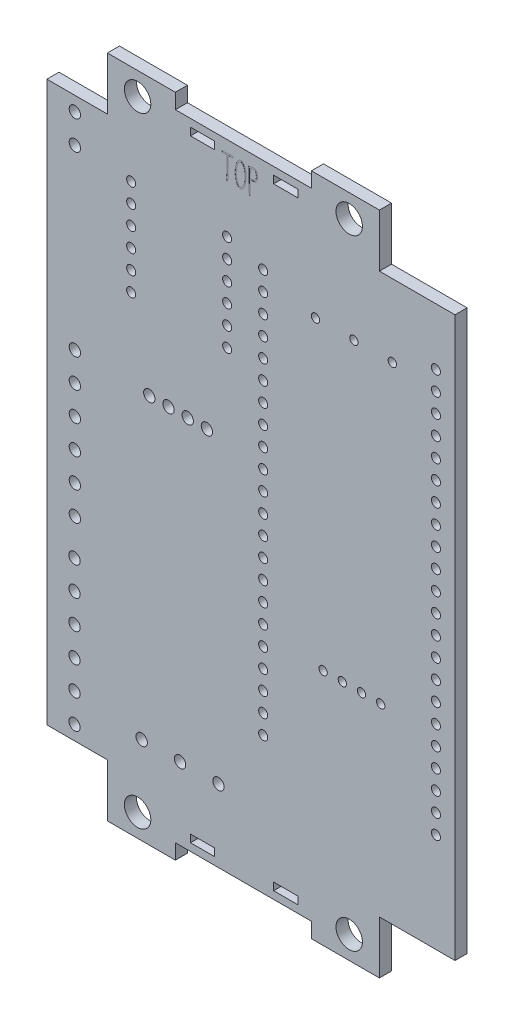
from build123d import *

# Parameters (mm, degrees)
SKETCH_1_W             = 54
SKETCH_1_H             = 88
EXTRUDE_1_DEPTH        = 1.6
SKETCH_2_R             = 1.75
CUT_EXTRUDE_1_DEPTH    = 10
SKETCH_3_R             = 0.6
CUT_EXTRUDE_2_DEPTH    = 10
PATTERN_LINEAR_1_COUNT = 22
PATTERN_LINEAR_1_PITCH = 2.54
SKETCH_4_R             = 0.75
CUT_EXTRUDE_3_DEPTH    = 10
PATTERN_LINEAR_2_COUNT = 6
PATTERN_LINEAR_2_PITCH = 3.81
SKETCH_5_R             = 0.75
CUT_EXTRUDE_4_DEPTH    = 10
PATTERN_LINEAR_3_COUNT = 2
PATTERN_LINEAR_3_PITCH = 3.81
SKETCH_6_R             = 0.6
CUT_EXTRUDE_5_DEPTH    = 10
PATTERN_LINEAR_4_COUNT = 6
PATTERN_LINEAR_4_PITCH = 2.54
SKETCH_7_W             = 8
SKETCH_7_H             = 7
SKETCH_7_W_2           = 10
CUT_EXTRUDE_6_DEPTH    = 10
SKETCH_8_R             = 0.55
CUT_EXTRUDE_7_DEPTH    = 10
SKETCH_9_R             = 0.75
CUT_EXTRUDE_8_DEPTH    = 10
SKETCH_10_W            = 18
SKETCH_10_H            = 1.6
CUT_EXTRUDE_9_DEPTH    = 2
CUT_EXTRUDE_10_DEPTH   = 0.01
SKETCH_12_W            = 3.2
SKETCH_12_H            = 1
CUT_EXTRUDE_11_DEPTH   = 104.259672809
CUT_EXTRUDE_12_DEPTH   = 0.01
CUT_EXTRUDE_13_DEPTH   = 0.01
CUT_EXTRUDE_14_DEPTH   = 0.01
CUT_EXTRUDE_15_DEPTH   = 0.01
SKETCH_17_W            = 8
SKETCH_17_H            = 8
EXTRUDE_2_DEPTH        = 4.5


with BuildPart() as part:
    # 草图1 → 凸台-拉伸1 (new body)
    with BuildSketch(Plane.XY):
        with Locations((27, 44)):
            Rectangle(SKETCH_1_W, SKETCH_1_H)
    extrude(amount=EXTRUDE_1_DEPTH)

    # 草图2 → 切除-拉伸1 (cut)
    with BuildSketch(Plane.XY.offset(1.6)):
        with Locations((12, 85)):
            Circle(SKETCH_2_R)
        with Locations((40, 85)):
            Circle(SKETCH_2_R)
        with Locations((12, 3)):
            Circle(SKETCH_2_R)
        with Locations((40, 3)):
            Circle(SKETCH_2_R)
    extrude(amount=-CUT_EXTRUDE_1_DEPTH, mode=Mode.SUBTRACT)

    # 草图3 → 切除-拉伸2 (cut)
    with BuildSketch(Plane(origin=(0, 0, 0), x_dir=(-1, 0, 0), z_dir=(0, 0, -1))):
        with Locations((-51.476, 73.476)):
            Circle(SKETCH_3_R)
        with Locations((-28.616, 73.476)):
            Circle(SKETCH_3_R)
    cut_extrude_2 = extrude(amount=-CUT_EXTRUDE_2_DEPTH, mode=Mode.SUBTRACT)

    # 阵列(线性)1: 切除-拉伸2 ×22
    with Locations(*[(0, -i * PATTERN_LINEAR_1_PITCH, 0) for i in range(1, PATTERN_LINEAR_1_COUNT)]):
        add(cut_extrude_2, mode=Mode.SUBTRACT)

    # 草图4 → 切除-拉伸3 (cut)
    with BuildSketch(Plane(origin=(0, 0, 0), x_dir=(-1, 0, 0), z_dir=(0, 0, -1))):
        with Locations((-3.7, 51.815)):
            Circle(SKETCH_4_R)
        with Locations((-3.651815313, 27.955)):
            Circle(SKETCH_4_R)
    cut_extrude_3 = extrude(amount=-CUT_EXTRUDE_3_DEPTH, mode=Mode.SUBTRACT)

    # 阵列(线性)2: 切除-拉伸3 ×6
    with Locations(*[(0, -i * PATTERN_LINEAR_2_PITCH, 0) for i in range(1, PATTERN_LINEAR_2_COUNT)]):
        add(cut_extrude_3, mode=Mode.SUBTRACT)

    # 草图5 → 切除-拉伸4 (cut)
    with BuildSketch(Plane(origin=(0, 0, 0), x_dir=(-1, 0, 0), z_dir=(0, 0, -1))):
        with Locations((-3.7, 79.095)):
            Circle(SKETCH_5_R)
    cut_extrude_4 = extrude(amount=-CUT_EXTRUDE_4_DEPTH, mode=Mode.SUBTRACT)

    # 阵列(线性)3: 切除-拉伸4 ×2
    with Locations(*[(0, -i * PATTERN_LINEAR_3_PITCH, 0) for i in range(1, PATTERN_LINEAR_3_COUNT)]):
        add(cut_extrude_4, mode=Mode.SUBTRACT)

    # 草图6 → 切除-拉伸5 (cut)
    with BuildSketch(Plane.XY.offset(1.6)):
        with Locations((11.15, 74.85)):
            Circle(SKETCH_6_R)
        with Locations((23.85, 74.85)):
            Circle(SKETCH_6_R)
    cut_extrude_5 = extrude(amount=-CUT_EXTRUDE_5_DEPTH, mode=Mode.SUBTRACT)

    # 阵列(线性)4: 切除-拉伸5 ×6
    with Locations(*[(0, -i * PATTERN_LINEAR_4_PITCH, 0) for i in range(1, PATTERN_LINEAR_4_COUNT)]):
        add(cut_extrude_5, mode=Mode.SUBTRACT)

    # 草图7 → 切除-拉伸6 (cut)
    with BuildSketch(Plane.XY.offset(1.6)):
        with Locations((4, 84.5)):
            Rectangle(SKETCH_7_W, SKETCH_7_H)
        with Locations((49, 84.5)):
            Rectangle(SKETCH_7_W_2, SKETCH_7_H)
        with Locations((4, 3.5)):
            Rectangle(SKETCH_7_W, SKETCH_7_H)
        with Locations((49, 3.5)):
            Rectangle(SKETCH_7_W_2, SKETCH_7_H)
    extrude(amount=-CUT_EXTRUDE_6_DEPTH, mode=Mode.SUBTRACT)

    # 草图8 → 切除-拉伸7 (cut)
    with BuildSketch(Plane(origin=(0, 0, 0), x_dir=(-1, 0, 0), z_dir=(0, 0, -1))):
        with Locations((-45.7, 71.4)):
            Circle(SKETCH_8_R)
        with Locations((-40.62, 71.4)):
            Circle(SKETCH_8_R)
        with Locations((-35.54, 71.4)):
            Circle(SKETCH_8_R)
        with Locations((-44.17, 31.5)):
            Circle(SKETCH_8_R)
        with Locations((-41.63, 31.5)):
            Circle(SKETCH_8_R)
        with Locations((-39.09, 31.5)):
            Circle(SKETCH_8_R)
        with Locations((-36.55, 31.5)):
            Circle(SKETCH_8_R)
    extrude(amount=-CUT_EXTRUDE_7_DEPTH, mode=Mode.SUBTRACT)

    # 草图9 → 切除-拉伸8 (cut)
    with BuildSketch(Plane.XY.offset(1.6)):
        with Locations((13.55, 51.5)):
            Circle(SKETCH_9_R)
        with Locations((16.09, 51.5)):
            Circle(SKETCH_9_R)
        with Locations((18.63, 51.5)):
            Circle(SKETCH_9_R)
        with Locations((21.17, 51.5)):
            Circle(SKETCH_9_R)
        with Locations((12.54, 11.6)):
            Circle(SKETCH_9_R)
        with Locations((17.62, 11.6)):
            Circle(SKETCH_9_R)
        with Locations((22.7, 11.6)):
            Circle(SKETCH_9_R)
    extrude(amount=-CUT_EXTRUDE_8_DEPTH, mode=Mode.SUBTRACT)

    # 草图10 → 切除-拉伸9 (cut)
    with BuildSketch(Plane.XZ):
        with Locations((26, 0.8)):
            Rectangle(SKETCH_10_W, SKETCH_10_H)
    cut_extrude_9 = extrude(amount=-CUT_EXTRUDE_9_DEPTH, mode=Mode.SUBTRACT)

    # 镜向1: 切除-拉伸9 across plane
    add(cut_extrude_9.mirror(Plane(origin=(0, 44, 0), x_dir=(0, 0, 1), z_dir=(0, -1, 0))), mode=Mode.SUBTRACT)

    # 草图11 → 切除-拉伸10 (cut)
    # profile 1 of 3: a face of its own
    with BuildSketch(Plane.XY.offset(1.6)):
        with BuildLine():
            Line((23.946203667, 84.253386462), (23.946203667, 81.827326372))
            Line((23.946203667, 81.827326372), (23.920846753, 81.32913758))
            add(Edge.make_bspline(
                [(23.920846753, 81.32913758), (23.920548353, 81.304904906), (23.92001296, 81.261426403), (23.911582799, 81.212251038), (23.903393411, 81.181574075), (23.897639878, 81.169799284), (23.892171246, 81.159755543), (23.887637437, 81.161938664), (23.885794547, 81.162826052)],
                knots=[0, 0, 0, 0, 2.43675652, 4.372052466, 5.078871199, 5.550454925, 5.817270194, 6, 6, 6, 6], degree=3))
            add(Edge.make_bspline(
                [(23.885794547, 81.162826052), (23.883537477, 81.163504176), (23.877975169, 81.165175338), (23.867027939, 81.171285005), (23.85586361, 81.190509774), (23.845072003, 81.219144375), (23.832987434, 81.251610623), (23.82769733, 81.273902297), (23.825385427, 81.283644292)],
                knots=[0, 0, 0, 0, 0.30288637, 0.746430801, 1.570370807, 3.058663464, 4.714565407, 6, 6, 6, 6], degree=3))
            Line((23.825385427, 81.283644292), (23.764976307, 81.464871652))
            add(Edge.make_bspline(
                [(23.764976307, 81.464871652), (23.759199213, 81.480755493), (23.749043375, 81.508678473), (23.736553272, 81.545304919), (23.729958825, 81.57141685), (23.727913131, 81.594431308), (23.738044829, 81.618574846), (23.750062124, 81.650059153), (23.763438221, 81.686798885), (23.7733009, 81.727529231), (23.779596364, 81.772050205), (23.785818669, 81.824017101), (23.791785262, 81.889190561), (23.798387153, 81.970698738), (23.805050132, 82.068119929), (23.805180465, 82.138058945), (23.805249054, 82.17486526)],
                knots=[0, 0, 0, 0, 0.980641267, 1.723917205, 2.241620292, 2.544775778, 3.041991924, 3.722164793, 4.515637936, 5.302532678, 6.148880555, 7.121858782, 8.338588997, 9.944421189, 11.865699026, 14, 14, 14, 14], degree=3))
            Line((23.805249054, 82.17486526), (23.805249054, 84.248911712))
            add(Edge.make_bspline(
                [(23.805249054, 84.248911712), (23.79107152, 84.248849536), (23.764933554, 84.248734907), (23.731169156, 84.246123664), (23.698830899, 84.24421087), (23.661298385, 84.241099072), (23.609342334, 84.23662402), (23.548736267, 84.230802575), (23.489233264, 84.226594192), (23.441838778, 84.221619316), (23.411236238, 84.219358837), (23.396555777, 84.218573625), (23.392080505, 84.218334256)],
                knots=[0, 0, 0, 0, 1.025992475, 1.891538789, 2.450608741, 3.371279513, 4.617765367, 6.225964987, 7.778834079, 8.935698997, 9.675552692, 10, 10, 10, 10], degree=3))
            Line((23.392080505, 84.218334256), (23.291398639, 84.203418424))
            Line((23.291398639, 84.203418424), (23.120612361, 84.349593579))
            add(Edge.make_bspline(
                [(23.120612361, 84.349593579), (23.112512354, 84.357440106), (23.099997147, 84.369563664), (23.088213517, 84.389567971), (23.091804748, 84.403076725), (23.09722145, 84.414206708), (23.112306384, 84.419661584), (23.123625571, 84.419684476), (23.130307652, 84.419697989)],
                knots=[0, 0, 0, 0, 1.88901374, 2.918688365, 3.546721585, 4.117087209, 4.888455958, 6, 6, 6, 6], degree=3))
            add(Edge.make_bspline(
                [(23.130307652, 84.419697989), (23.133526906, 84.418867821), (23.144241804, 84.416104706), (23.167915243, 84.416192105), (23.204832478, 84.413754659), (23.234205056, 84.41421326), (23.251125892, 84.414477448)],
                knots=[0, 0, 0, 0, 0.328519165, 1.093436259, 2.325598431, 4, 4, 4, 4], degree=3))
            Line((23.251125892, 84.414477448), (23.331671385, 84.410002699))
            add(Edge.make_bspline(
                [(23.331671385, 84.410002699), (23.334639075, 84.409129808), (23.3440847, 84.406351555), (23.365082969, 84.408647922), (23.397289011, 84.406981679), (23.422897032, 84.408902065), (23.437573793, 84.410002699)],
                knots=[0, 0, 0, 0, 0.347341643, 1.105526146, 2.341086076, 4, 4, 4, 4], degree=3))
            Line((23.437573793, 84.410002699), (23.543476201, 84.410002699))
            Line((23.543476201, 84.410002699), (23.805249054, 84.419697989))
            Line((23.805249054, 84.419697989), (24.016308078, 84.424918531))
            add(Edge.make_bspline(
                [(24.016308078, 84.424918531), (24.034486262, 84.425587717), (24.076752059, 84.427143631), (24.14507144, 84.438315014), (24.221531959, 84.44896941), (24.285937463, 84.456648161), (24.33270505, 84.460557845), (24.358926759, 84.465419991), (24.377311241, 84.468898807), (24.386013642, 84.473280332), (24.38920388, 84.474886568)],
                knots=[0, 0, 0, 0, 1.156915626, 2.689925566, 4.399695503, 6.072075551, 6.820020126, 7.381954211, 7.77342877, 8, 8, 8, 8], degree=3))
            Line((24.38920388, 84.474886568), (24.495106288, 84.515159315))
            Line((24.495106288, 84.515159315), (24.640535651, 84.333931955))
            add(Edge.make_bspline(
                [(24.640535651, 84.333931955), (24.647259467, 84.324485921), (24.657901334, 84.309535566), (24.668230489, 84.289529085), (24.669551475, 84.276794519), (24.667211491, 84.26765288), (24.657888747, 84.265377605), (24.64608098, 84.265609037), (24.627866597, 84.263085328), (24.613683022, 84.26355565), (24.605483446, 84.263827544)],
                knots=[0, 0, 0, 0, 2.075716626, 3.285262792, 3.906827215, 4.383787294, 4.762155351, 5.472092002, 6.53860716, 8, 8, 8, 8], degree=3))
            Line((24.605483446, 84.263827544), (24.499581038, 84.263827544))
            Line((24.499581038, 84.263827544), (24.122210486, 84.258607003))
            add(Edge.make_bspline(
                [(24.122210486, 84.258607003), (24.103318047, 84.25945899), (24.069271704, 84.260994368), (24.024281117, 84.261655882), (23.99111226, 84.261662146), (23.973292886, 84.259464493), (23.966340041, 84.258607003)],
                knots=[0, 0, 0, 0, 1.454015493, 2.620302767, 3.461663352, 4, 4, 4, 4], degree=3))
            Line((23.966340041, 84.258607003), (23.946203667, 84.253386462))
        make_face()
    # profile 2 of 3: a face of its own
    with BuildSketch(Plane.XY.offset(1.6)):
        with BuildLine():
            add(Edge.make_bspline(
                [(24.909020629, 82.940047446), (24.912086765, 82.988311022), (24.918404761, 83.087761642), (24.936283092, 83.240411626), (24.959387009, 83.401111761), (24.988246884, 83.566309578), (25.02434973, 83.729993524), (25.073637912, 83.883346865), (25.132398173, 84.024610333), (25.201820768, 84.149965957), (25.274579775, 84.258144183), (25.344860313, 84.346535629), (25.411014662, 84.414496524), (25.476195663, 84.460201615), (25.53826078, 84.488422047), (25.595198888, 84.508023583), (25.648523734, 84.52080327), (25.683091186, 84.520516485), (25.69955973, 84.520379856)],
                knots=[0, 0, 0, 0, 1.217793816, 2.509352989, 3.869389901, 5.306369188, 6.732518591, 8.086865491, 9.357865112, 10.57959578, 11.689225504, 12.637700741, 13.421327601, 14.069152645, 14.629329011, 15.132240194, 15.586583926, 16, 16, 16, 16], degree=3))
            add(Edge.make_bspline(
                [(25.69955973, 84.520379856), (25.715351237, 84.517639704), (25.748928268, 84.511813397), (25.799988327, 84.49176184), (25.855162508, 84.464276107), (25.913072758, 84.427050286), (25.971261421, 84.379652722), (26.026287318, 84.319898489), (26.075987202, 84.247392277), (26.137188765, 84.134643104), (26.20378084, 83.979752206), (26.256312045, 83.815126139), (26.290379881, 83.676329753), (26.313881691, 83.565494459), (26.33283001, 83.448442303), (26.354465706, 83.285382381), (26.373920535, 83.078190086), (26.370822349, 82.911750362), (26.36928059, 82.828924497)],
                knots=[0, 0, 0, 0, 0.394985608, 0.839846589, 1.347857167, 1.916750551, 2.536277094, 3.196746505, 3.915575437, 4.701623328, 6.36253532, 8.071356979, 8.963406565, 9.891884595, 10.869033514, 11.891140732, 13.955296867, 16, 16, 16, 16], degree=3))
            add(Edge.make_bspline(
                [(26.36928059, 82.828924497), (26.367988566, 82.797839384), (26.36530843, 82.733357393), (26.357176564, 82.633807027), (26.343748982, 82.52826258), (26.323652528, 82.378875001), (26.286005019, 82.18772417), (26.233964569, 81.998357618), (26.182819029, 81.850215724), (26.138902686, 81.744663443), (26.090353476, 81.644489686), (26.036669664, 81.552102685), (25.98089168, 81.468956052), (25.921139455, 81.400029467), (25.860745802, 81.344654394), (25.797812486, 81.305599881), (25.73704322, 81.27902585), (25.680684936, 81.26054032), (25.628004158, 81.251474621), (25.594675132, 81.252551846), (25.57874149, 81.253066837)],
                knots=[0, 0, 0, 0, 0.881282943, 1.828105941, 2.82824081, 3.894865892, 6.097710261, 8.340987808, 9.452332789, 10.535200188, 11.577677107, 12.603151353, 13.560288859, 14.408919748, 15.182050945, 15.871786862, 16.496001568, 17.057257397, 17.549302039, 18, 18, 18, 18], degree=3))
            add(Edge.make_bspline(
                [(25.57874149, 81.253066837), (25.562227913, 81.255028942), (25.527562477, 81.259147809), (25.474654907, 81.276715386), (25.418752344, 81.303204886), (25.359683553, 81.338806467), (25.29988313, 81.386700548), (25.244375308, 81.450855111), (25.190365815, 81.528180114), (25.140831907, 81.619702695), (25.094499668, 81.721473242), (25.053070998, 81.831298702), (25.015701126, 81.947268988), (24.983237361, 82.067973047), (24.957223546, 82.190621396), (24.934968466, 82.310861541), (24.920466659, 82.427698105), (24.910311644, 82.540135688), (24.906717234, 82.647925202), (24.904036272, 82.750349123), (24.904578156, 82.847119004), (24.907571072, 82.909725361), (24.909020629, 82.940047446)],
                knots=[0, 0, 0, 0, 0.510534934, 1.071719088, 1.704710998, 2.411693894, 3.189282936, 4.05053371, 5.011670478, 6.086573801, 7.246791516, 8.449877322, 9.695482973, 10.994127406, 12.29322218, 13.551907867, 14.754774865, 15.913908135, 17.0238299, 18.071869134, 19.066149983, 20, 20, 20, 20], degree=3))
        make_face()
        with BuildLine():
            add(Edge.make_bspline(
                [(25.055195783, 82.929606364), (25.053784308, 82.904753182), (25.050807797, 82.852342915), (25.049658046, 82.769510951), (25.050327687, 82.678494622), (25.055120051, 82.54495623), (25.07249237, 82.368677194), (25.103107008, 82.190372061), (25.137567469, 82.048431664), (25.167297523, 81.946691444), (25.199980917, 81.850350054), (25.236737304, 81.761395399), (25.275788599, 81.681183303), (25.31888769, 81.613682092), (25.361983007, 81.556879934), (25.40993267, 81.515418322), (25.456329003, 81.483312754), (25.501195626, 81.461518216), (25.542864486, 81.444798161), (25.570655967, 81.44122534), (25.583962031, 81.439514738)],
                knots=[0, 0, 0, 0, 0.796536737, 1.679732718, 2.650327695, 3.709147218, 5.954918549, 8.313069364, 9.492003862, 10.627402775, 11.704181224, 12.745734999, 13.706334556, 14.553839847, 15.30675304, 15.97732542, 16.573080319, 17.10674674, 17.572326302, 18, 18, 18, 18], degree=3))
            add(Edge.make_bspline(
                [(25.583962031, 81.439514738), (25.597662122, 81.438708411), (25.626020322, 81.437039374), (25.669585194, 81.445594169), (25.715172834, 81.460644606), (25.762382668, 81.484923689), (25.811306352, 81.519609333), (25.858099876, 81.569702707), (25.904780955, 81.632805266), (25.950577622, 81.707976803), (25.99462089, 81.79134402), (26.033747998, 81.88066021), (26.07012502, 81.97289811), (26.110036398, 82.102202864), (26.154044455, 82.268529256), (26.188635348, 82.471681121), (26.212723375, 82.669847517), (26.225558387, 82.830721958), (26.227467371, 82.958702996), (26.224944693, 83.061918169), (26.219265676, 83.17413072), (26.211969911, 83.251810987), (26.208189604, 83.292061083)],
                knots=[0, 0, 0, 0, 0.389303871, 0.805830913, 1.253424913, 1.753499798, 2.311288848, 2.951911425, 3.695005091, 4.54345845, 5.455166886, 6.377091015, 7.318103512, 8.276048787, 10.227707478, 12.21152619, 14.136557685, 15.91040834, 16.802233067, 17.779101204, 18.849239395, 20, 20, 20, 20], degree=3))
            add(Edge.make_bspline(
                [(26.208189604, 83.292061083), (26.204029059, 83.328648461), (26.195942698, 83.399759048), (26.179065745, 83.50208433), (26.161751952, 83.597574898), (26.133458675, 83.714573183), (26.092536255, 83.85605102), (26.039919439, 83.99157141), (25.991953686, 84.093504675), (25.953288336, 84.159736026), (25.909260054, 84.213540144), (25.863273668, 84.25618058), (25.816579352, 84.288025854), (25.7726946, 84.312563696), (25.730370536, 84.32843961), (25.702399435, 84.332163729), (25.689118647, 84.333931955)],
                knots=[0, 0, 0, 0, 1.251575308, 2.432539829, 3.524812851, 4.549720602, 6.523204923, 8.527303315, 9.483611249, 10.351763581, 11.126540771, 11.838283349, 12.475927762, 13.043152764, 13.545685196, 14, 14, 14, 14], degree=3))
            add(Edge.make_bspline(
                [(25.689118647, 84.333931955), (25.67615941, 84.332990461), (25.648696978, 84.330995304), (25.60589031, 84.321402696), (25.561406184, 84.302118519), (25.511636288, 84.278849961), (25.459139303, 84.239637411), (25.405970485, 84.180490102), (25.350019691, 84.102009431), (25.290222722, 84.006685003), (25.23295386, 83.894851393), (25.186135515, 83.767298875), (25.14521792, 83.627982369), (25.117077997, 83.47876513), (25.093657787, 83.32942769), (25.076211326, 83.186817969), (25.061736675, 83.054884215), (25.057312959, 82.970156682), (25.055195783, 82.929606364)],
                knots=[0, 0, 0, 0, 0.37757334, 0.800130614, 1.267198275, 1.784369715, 2.394414205, 3.156344445, 4.08734282, 5.194407036, 6.425938495, 7.73207238, 9.1388751, 10.642807986, 12.142427514, 13.533772035, 14.819671431, 16, 16, 16, 16], degree=3))
        make_face(mode=Mode.SUBTRACT)
    # profile 3 of 3: a face of its own
    with BuildSketch(Plane.XY.offset(1.6)):
        with BuildLine():
            add(Edge.make_bspline(
                [(26.939811168, 84.419697989), (26.978381949, 84.426214495), (27.052388033, 84.438717768), (27.159794194, 84.460121568), (27.263465131, 84.478182997), (27.332525192, 84.482941756), (27.367149757, 84.485327651)],
                knots=[0, 0, 0, 0, 1.084781132, 2.081378719, 3.038062992, 4, 4, 4, 4], degree=3))
            add(Edge.make_bspline(
                [(27.367149757, 84.485327651), (27.387052725, 84.485757492), (27.424952822, 84.486576015), (27.478621672, 84.481089668), (27.526565838, 84.472156662), (27.568947308, 84.455749587), (27.607857085, 84.433578603), (27.645132555, 84.404334335), (27.681392022, 84.367750073), (27.716751622, 84.32324727), (27.749808956, 84.270425722), (27.777151159, 84.207235682), (27.800453237, 84.134897268), (27.821173827, 84.026742246), (27.841484608, 83.890426469), (27.848495199, 83.756032935), (27.848764646, 83.655478184), (27.845801508, 83.586797021), (27.840223941, 83.523252072), (27.833510919, 83.48295142), (27.830286344, 83.463593152)],
                knots=[0, 0, 0, 0, 0.834042403, 1.588219797, 2.258865872, 2.872645434, 3.484296274, 4.130763207, 4.85321558, 5.639635085, 6.510463327, 7.457868132, 8.519533185, 9.691141985, 12.070813463, 14.294972691, 15.327100164, 16.287155067, 17.177241371, 18, 18, 18, 18], degree=3))
            add(Edge.make_bspline(
                [(27.830286344, 83.463593152), (27.826179138, 83.44088659), (27.818173106, 83.396625482), (27.80036807, 83.333407921), (27.781647602, 83.273946059), (27.758304626, 83.220217012), (27.733780403, 83.170757972), (27.706307248, 83.127244414), (27.677158686, 83.0882585), (27.635237515, 83.045875842), (27.578931577, 83.002986169), (27.505124997, 82.969959963), (27.430490422, 82.954011545), (27.381379055, 82.951141082), (27.357454466, 82.949742737)],
                knots=[0, 0, 0, 0, 1.080384674, 2.105956013, 3.074594822, 3.998289199, 4.84730105, 5.658400013, 6.406150959, 7.122683501, 8.445750941, 9.696890862, 10.878041055, 12, 12, 12, 12], degree=3))
            Line((27.357454466, 82.949742737), (27.161311274, 82.940047446))
            Line((27.161311274, 82.940047446), (26.899538421, 82.904249449))
            Line((26.899538421, 82.904249449), (26.89431788, 81.555112436))
            add(Edge.make_bspline(
                [(26.89431788, 81.555112436), (26.893751611, 81.525273575), (26.892732076, 81.471550375), (26.889044648, 81.400007248), (26.887689129, 81.345970093), (26.883201108, 81.296062143), (26.878018313, 81.24086762), (26.870697434, 81.188327116), (26.865030797, 81.146726869), (26.859041914, 81.127196161), (26.85372481, 81.110595348), (26.846303434, 81.111707646), (26.843604051, 81.112112223)],
                knots=[0, 0, 0, 0, 1.96874048, 3.54460707, 4.726507013, 5.532831549, 6.851459339, 8.37313705, 9.071482733, 9.549088405, 9.835989539, 10, 10, 10, 10], degree=3))
            add(Edge.make_bspline(
                [(26.843604051, 81.112112223), (26.842615059, 81.112863036), (26.838381934, 81.116076695), (26.828040218, 81.12278369), (26.817521595, 81.142104977), (26.811927551, 81.158283641), (26.808551845, 81.168046594)],
                knots=[0, 0, 0, 0, 0.220639879, 0.944392497, 2.156105254, 4, 4, 4, 4], degree=3))
            Line((26.808551845, 81.168046594), (26.783194931, 81.232930463))
            Line((26.783194931, 81.232930463), (26.722785811, 81.414157823))
            add(Edge.make_bspline(
                [(26.722785811, 81.414157823), (26.717151954, 81.431573438), (26.707334986, 81.461920057), (26.693695808, 81.50087545), (26.687026759, 81.52717571), (26.683241991, 81.547794506), (26.692311484, 81.568215142), (26.703717041, 81.595967339), (26.719461958, 81.632312843), (26.730761218, 81.677189343), (26.741545741, 81.725215093), (26.751319119, 81.775824222), (26.757356717, 81.831398612), (26.758940767, 81.884491601), (26.758145313, 81.936969717), (26.760680781, 81.989396211), (26.760388853, 82.053071322), (26.762124987, 82.09929539), (26.763058558, 82.124151431)],
                knots=[0, 0, 0, 0, 1.21093634, 2.110050319, 2.719907809, 3.017552618, 3.464624392, 4.142243825, 5.027278712, 6.067997939, 7.196380019, 8.282686609, 9.473265847, 10.887508473, 11.791416163, 12.942313598, 14.355792079, 16, 16, 16, 16], degree=3))
            Line((26.763058558, 82.124151431), (26.77349964, 84.198197883))
            add(Edge.make_bspline(
                [(26.77349964, 84.198197883), (26.762731725, 84.219816417), (26.742944282, 84.259543285), (26.71057092, 84.309795569), (26.685418463, 84.348071012), (26.67263807, 84.378424651), (26.668965517, 84.401204022), (26.668020588, 84.413975846), (26.667597232, 84.419697989)],
                knots=[0, 0, 0, 0, 1.750659444, 3.217064329, 4.333728491, 5.070582308, 5.583594197, 6, 6, 6, 6], degree=3))
            add(Edge.make_bspline(
                [(26.667597232, 84.419697989), (26.668269455, 84.422652118), (26.669818337, 84.429458786), (26.681723378, 84.435357425), (26.698128085, 84.435488167), (26.710843566, 84.43493732), (26.718311061, 84.434613821)],
                knots=[0, 0, 0, 0, 0.599620471, 1.381597738, 2.462275397, 4, 4, 4, 4], degree=3))
            Line((26.718311061, 84.434613821), (26.768279099, 84.424918531))
            Line((26.768279099, 84.424918531), (26.939811168, 84.419697989))
        make_face()
        with BuildLine():
            Line((26.899538421, 83.081002059), (27.236636226, 83.116054265))
            add(Edge.make_bspline(
                [(27.236636226, 83.116054265), (27.267006149, 83.119153811), (27.331133765, 83.12569866), (27.412162166, 83.140531643), (27.477535666, 83.160253601), (27.523925794, 83.18014774), (27.564444224, 83.206696789), (27.600542321, 83.238363693), (27.630568782, 83.277550092), (27.656625863, 83.32334016), (27.674334586, 83.378050127), (27.693040027, 83.460707408), (27.706646598, 83.572294503), (27.708517971, 83.663432058), (27.709468104, 83.709704382)],
                knots=[0, 0, 0, 0, 1.242290402, 2.623158502, 3.343124827, 4.017967388, 4.668958523, 5.306607609, 5.962297971, 6.668776287, 7.439809609, 8.291324773, 10.117032856, 12, 12, 12, 12], degree=3))
            add(Edge.make_bspline(
                [(27.709468104, 83.709704382), (27.707475269, 83.739060849), (27.703583746, 83.796386916), (27.693844513, 83.879487547), (27.681505348, 83.957774452), (27.664856037, 84.029787801), (27.647732187, 84.095027034), (27.624806888, 84.149960427), (27.600853404, 84.195457574), (27.57259652, 84.23163878), (27.53868156, 84.258147886), (27.501124236, 84.280828446), (27.456081336, 84.294994516), (27.424142842, 84.300971329), (27.407422504, 84.304100291)],
                knots=[0, 0, 0, 0, 1.450841259, 2.833141438, 4.12506739, 5.356415584, 6.477956507, 7.445537896, 8.28503356, 9.008768821, 9.688489171, 10.397114349, 11.160862483, 12, 12, 12, 12], degree=3))
            add(Edge.make_bspline(
                [(27.407422504, 84.304100291), (27.385048129, 84.305283987), (27.339533029, 84.307691922), (27.269251751, 84.303014808), (27.195873671, 84.294709125), (27.1463256, 84.284138262), (27.121038528, 84.278743376)],
                knots=[0, 0, 0, 0, 0.931107193, 1.894105981, 2.925247858, 4, 4, 4, 4], degree=3))
            Line((27.121038528, 84.278743376), (26.914454253, 84.233250088))
            Line((26.914454253, 84.233250088), (26.899538421, 83.081002059))
        make_face(mode=Mode.SUBTRACT)
    extrude(amount=-CUT_EXTRUDE_10_DEPTH, mode=Mode.SUBTRACT)

    # 草图12 → 切除-拉伸11 (cut, through all)
    with BuildSketch(Plane(origin=(0, 0, 0), x_dir=(-1, 0, 0), z_dir=(0, 0, -1))):
        with Locations((-31.6, 84.5)):
            Rectangle(SKETCH_12_W, SKETCH_12_H)
        with Locations((-20.6, 84.5)):
            Rectangle(SKETCH_12_W, SKETCH_12_H)
        with Locations((-31.6, 3.5)):
            Rectangle(SKETCH_12_W, SKETCH_12_H)
        with Locations((-20.6, 3.5)):
            Rectangle(SKETCH_12_W, SKETCH_12_H)
    extrude(amount=-CUT_EXTRUDE_11_DEPTH, mode=Mode.SUBTRACT)

    # 草图13 → 切除-拉伸12 (cut)
    with BuildSketch(Plane(origin=(0, 0, 0), x_dir=(-1, 0, 0), z_dir=(0, 0, -1))):
        with BuildLine():
            Line((-20.811859545, 5.844463109), (-20.789531098, 5.97974723))
            Line((-20.789531098, 5.97974723), (-20.76753101, 5.977448713))
            Line((-20.76753101, 5.977448713), (-20.76753101, 5.423506209))
            Line((-20.76753101, 5.423506209), (-20.794128131, 5.421207692))
            Line((-20.794128131, 5.421207692), (-20.809561028, 5.655984747))
            add(Edge.make_bspline(
                [(-20.809561028, 5.655984747), (-20.811592988, 5.669040109), (-20.815349128, 5.693173357), (-20.822711961, 5.725855196), (-20.829541004, 5.752599889), (-20.840122939, 5.779703241), (-20.855825946, 5.808639594), (-20.878956401, 5.839654812), (-20.906708797, 5.867593189), (-20.939619885, 5.889570525), (-20.975290775, 5.906367463), (-21.00093666, 5.909559724), (-21.013472288, 5.911120091)],
                knots=[0, 0, 0, 0, 1.116474761, 2.063838624, 2.831507158, 3.446633667, 4.518832044, 5.603216916, 6.708904972, 7.82779241, 8.938231816, 10, 10, 10, 10], degree=3))
            add(Edge.make_bspline(
                [(-21.013472288, 5.911120091), (-21.020940933, 5.910799957), (-21.036274936, 5.910142683), (-21.055523304, 5.905615704), (-21.071927562, 5.899611811), (-21.085493953, 5.891887622), (-21.100415835, 5.881542503), (-21.116003711, 5.868699999), (-21.131677539, 5.85402539), (-21.145578744, 5.836971271), (-21.15778215, 5.818296272), (-21.170868087, 5.791377314), (-21.183898797, 5.757067479), (-21.192512998, 5.721531615), (-21.196278277, 5.691825643), (-21.198591094, 5.666745559), (-21.200076273, 5.638596413), (-21.201379257, 5.608159251), (-21.200259446, 5.576801553), (-21.195741059, 5.546136545), (-21.187606223, 5.516960854), (-21.179416644, 5.498830087), (-21.17535353, 5.489834831)],
                knots=[0, 0, 0, 0, 0.864038106, 1.773971445, 2.275285977, 2.88209936, 3.574564674, 4.376127188, 5.218616224, 6.055847121, 6.916999662, 7.795414815, 9.515900782, 11.157236165, 12.013901558, 12.981067707, 14.072720019, 15.277182195, 16.507433409, 17.699229733, 18.858513907, 20, 20, 20, 20], degree=3))
            add(Edge.make_bspline(
                [(-21.17535353, 5.489834831), (-21.170753247, 5.481493389), (-21.161781991, 5.465226301), (-21.145003626, 5.443569103), (-21.125299039, 5.426016472), (-21.097621698, 5.408133345), (-21.064422125, 5.39215052), (-21.038253226, 5.381582493), (-21.026606669, 5.376879158)],
                knots=[0, 0, 0, 0, 0.892298636, 1.740118821, 2.553971753, 3.353728668, 4.822268012, 6, 6, 6, 6], degree=3))
            Line((-21.026606669, 5.376879158), (-20.949113823, 5.345685004))
            add(Edge.make_bspline(
                [(-20.949113823, 5.345685004), (-20.939553157, 5.34127579), (-20.921144703, 5.332786131), (-20.895199684, 5.319280278), (-20.871709988, 5.305924782), (-20.844682847, 5.287835527), (-20.814902165, 5.26407735), (-20.785475567, 5.231311442), (-20.761563675, 5.194178381), (-20.74656465, 5.150881757), (-20.734751238, 5.103912166), (-20.7267747, 5.052886418), (-20.721508317, 4.997179294), (-20.719391548, 4.937579668), (-20.720329014, 4.875990779), (-20.728201906, 4.835785436), (-20.732068182, 4.816041103)],
                knots=[0, 0, 0, 0, 0.703245545, 1.354054533, 1.953549274, 2.507188807, 3.525842386, 4.488918984, 5.43838142, 6.454223102, 7.53246407, 8.673253088, 9.899948524, 11.268249991, 12.658472344, 14, 14, 14, 14], degree=3))
            add(Edge.make_bspline(
                [(-20.732068182, 4.816041103), (-20.736902235, 4.796240076), (-20.746265502, 4.757886688), (-20.766523172, 4.713821542), (-20.784280322, 4.682661475), (-20.797435226, 4.662467531), (-20.810589305, 4.645113572), (-20.827780762, 4.624747579), (-20.854294822, 4.603278968), (-20.885228695, 4.586183354), (-20.913703197, 4.575554671), (-20.937338059, 4.569478186), (-20.962714429, 4.566398213), (-20.980191613, 4.565806759), (-20.989173684, 4.565502792)],
                knots=[0, 0, 0, 0, 1.868422262, 3.619020558, 4.429541533, 5.162879566, 5.830420081, 6.429075538, 7.606854402, 8.938752151, 9.657684361, 10.394048182, 11.174651193, 12, 12, 12, 12], degree=3))
            add(Edge.make_bspline(
                [(-20.989173684, 4.565502792), (-20.999260111, 4.565566957), (-21.019002365, 4.565692546), (-21.047886601, 4.570364323), (-21.075143669, 4.578914877), (-21.100525992, 4.591628438), (-21.124264969, 4.607507702), (-21.146312315, 4.626344094), (-21.166702703, 4.647938846), (-21.185957203, 4.671874224), (-21.202822607, 4.698901495), (-21.218062188, 4.728296256), (-21.231097066, 4.76020968), (-21.245711181, 4.805250216), (-21.258553068, 4.862467653), (-21.262226206, 4.908791418), (-21.264010599, 4.931295294)],
                knots=[0, 0, 0, 0, 0.833862414, 1.63212638, 2.411403016, 3.189256699, 3.973153178, 4.770028097, 5.583768076, 6.428386665, 7.307987397, 8.215552436, 9.166047206, 10.157242313, 12.13320567, 14, 14, 14, 14], degree=3))
            Line((-21.264010599, 4.931295294), (-21.272876306, 5.048848001))
            Line((-21.272876306, 5.048848001), (-21.241682152, 5.048848001))
            add(Edge.make_bspline(
                [(-21.241682152, 5.048848001), (-21.239887767, 5.034938048), (-21.236435625, 5.008177268), (-21.23036995, 4.969574456), (-21.224523405, 4.933990128), (-21.217049856, 4.891463633), (-21.205358239, 4.843425275), (-21.186939315, 4.791219181), (-21.162887002, 4.745404101), (-21.137189842, 4.713220377), (-21.115091117, 4.690829702), (-21.097473698, 4.677974758), (-21.080312131, 4.666869894), (-21.057053255, 4.657371869), (-21.028072685, 4.64978286), (-21.004763772, 4.649855773), (-20.993442358, 4.649891188)],
                knots=[0, 0, 0, 0, 1.134650933, 2.182907786, 3.161205505, 4.052250561, 5.675932663, 7.155002512, 8.52184542, 9.839854562, 10.472309825, 11.060302883, 11.600982628, 12.120735338, 13.087218943, 14, 14, 14, 14], degree=3))
            add(Edge.make_bspline(
                [(-20.993442358, 4.649891188), (-20.983449283, 4.65024838), (-20.964279908, 4.650933569), (-20.93686664, 4.656752001), (-20.911894784, 4.665668677), (-20.889891806, 4.679354681), (-20.870159285, 4.695874339), (-20.85235422, 4.715195703), (-20.836035872, 4.736957984), (-20.822427931, 4.76138949), (-20.810414379, 4.786643982), (-20.800540522, 4.811744686), (-20.793216278, 4.836252498), (-20.788250679, 4.860445173), (-20.784882743, 4.885463015), (-20.783166425, 4.912115548), (-20.781914741, 4.941032041), (-20.782604127, 4.960956748), (-20.782963907, 4.971355155)],
                knots=[0, 0, 0, 0, 1.108065456, 2.12556444, 3.098260599, 4.035950869, 4.98490885, 5.94776606, 6.946521194, 7.996930623, 9.045863326, 10.049925535, 10.987930625, 11.881525266, 12.788809675, 13.787786499, 14.845478855, 16, 16, 16, 16], degree=3))
            add(Edge.make_bspline(
                [(-20.782963907, 4.971355155), (-20.784113476, 4.987584727), (-20.78625906, 5.017875992), (-20.793216687, 5.059567061), (-20.801709904, 5.094585777), (-20.813043404, 5.123369799), (-20.826812535, 5.147167239), (-20.841283464, 5.168557236), (-20.857593831, 5.18763043), (-20.876177765, 5.204245489), (-20.896594586, 5.219647887), (-20.919582913, 5.23397099), (-20.945330849, 5.247576859), (-20.963822341, 5.25531387), (-20.973412427, 5.259326451)],
                knots=[0, 0, 0, 0, 1.578487453, 2.946127177, 4.097996722, 5.070650713, 5.936469873, 6.761635482, 7.575228913, 8.364955199, 9.176673428, 10.055112166, 10.991339211, 12, 12, 12, 12], degree=3))
            Line((-20.973412427, 5.259326451), (-21.068965046, 5.294789278))
            add(Edge.make_bspline(
                [(-21.068965046, 5.294789278), (-21.08383384, 5.301288975), (-21.113297641, 5.314168685), (-21.153513232, 5.340217744), (-21.188555708, 5.371751478), (-21.216774477, 5.410028879), (-21.238444172, 5.454595746), (-21.251683074, 5.49634914), (-21.259056998, 5.533861403), (-21.262337793, 5.565836156), (-21.264493082, 5.601010336), (-21.264176547, 5.625443753), (-21.264010599, 5.638253333)],
                knots=[0, 0, 0, 0, 1.141640751, 2.262259852, 3.359181592, 4.444772656, 5.58953336, 6.835542724, 7.519006772, 8.279340868, 9.097919025, 10, 10, 10, 10], degree=3))
            add(Edge.make_bspline(
                [(-21.264010599, 5.638253333), (-21.26391702, 5.649312122), (-21.263736125, 5.670689724), (-21.261437026, 5.70161621), (-21.257530494, 5.730119138), (-21.250530864, 5.764916279), (-21.238005395, 5.80578091), (-21.218548236, 5.851528208), (-21.196001013, 5.892390386), (-21.170080248, 5.926656297), (-21.14048688, 5.953447441), (-21.113544072, 5.971994339), (-21.089068755, 5.983009794), (-21.068081583, 5.988965752), (-21.044754589, 5.991998411), (-21.028474886, 5.992580169), (-21.020039478, 5.992881611)],
                knots=[0, 0, 0, 0, 0.971164436, 1.877345498, 2.721647718, 3.496542433, 4.992871533, 6.466013358, 7.856401207, 9.083219229, 10.219456221, 11.349985082, 11.939558551, 12.569451447, 13.258754286, 14, 14, 14, 14], degree=3))
            add(Edge.make_bspline(
                [(-21.020039478, 5.992881611), (-21.010584753, 5.991806065), (-20.991780593, 5.989666952), (-20.964199387, 5.982191742), (-20.937517748, 5.971458621), (-20.912599496, 5.956888227), (-20.88968244, 5.940664454), (-20.869062028, 5.923824914), (-20.852208557, 5.905604835), (-20.842933887, 5.892715351), (-20.838456666, 5.886493127)],
                knots=[0, 0, 0, 0, 1.049956055, 2.088219507, 3.145806661, 4.218152357, 5.268178035, 6.24663062, 7.15358473, 8, 8, 8, 8], degree=3))
            Line((-20.838456666, 5.886493127), (-20.811859545, 5.844463109))
        make_face()
        with BuildLine():
            Line((-20.225737808, 5.990911453), (-20.201439204, 5.990911453))
            Line((-20.201439204, 5.990911453), (-20.20373772, 4.813742587))
            add(Edge.make_bspline(
                [(-20.20373772, 4.813742587), (-20.203999564, 4.803126351), (-20.204501621, 4.7827709), (-20.204542368, 4.75364753), (-20.205500165, 4.727279019), (-20.205576453, 4.703627615), (-20.206288656, 4.682724217), (-20.20711225, 4.664564451), (-20.207190507, 4.649114275), (-20.208647297, 4.624932757), (-20.210383256, 4.591684972), (-20.214688343, 4.557440319), (-20.218115516, 4.53303957), (-20.22159952, 4.521931923), (-20.226013395, 4.513143189), (-20.230418434, 4.514168117), (-20.232304998, 4.514607067)],
                knots=[0, 0, 0, 0, 1.45038606, 2.780953852, 3.977268029, 5.053718292, 6.010937745, 6.833690271, 7.536464333, 8.120251454, 10.142880859, 12.069479857, 12.873132744, 13.440417135, 13.76034519, 14, 14, 14, 14], degree=3))
            add(Edge.make_bspline(
                [(-20.232304998, 4.514607067), (-20.232741112, 4.514937175), (-20.234607783, 4.516350118), (-20.239059279, 4.519340797), (-20.244348573, 4.527357491), (-20.246663896, 4.534549543), (-20.248066255, 4.538905672)],
                knots=[0, 0, 0, 0, 0.221265066, 0.947068446, 2.150880552, 4, 4, 4, 4], degree=3))
            Line((-20.248066255, 4.538905672), (-20.258902119, 4.567801309))
            Line((-20.258902119, 4.567801309), (-20.283529083, 4.647592671))
            add(Edge.make_bspline(
                [(-20.283529083, 4.647592671), (-20.286493638, 4.655100217), (-20.29165774, 4.668177972), (-20.29686718, 4.685383577), (-20.300819236, 4.696370082), (-20.301869661, 4.705275122), (-20.29680976, 4.713628074), (-20.293083317, 4.726489072), (-20.287349316, 4.74290529), (-20.281934455, 4.762280876), (-20.277151856, 4.78321589), (-20.272843569, 4.805835515), (-20.270401938, 4.83132031), (-20.269204224, 4.855652939), (-20.268285049, 4.879080159), (-20.268118049, 4.901634047), (-20.267657441, 4.928338539), (-20.267729397, 4.94760352), (-20.267767826, 4.957892415)],
                knots=[0, 0, 0, 0, 1.220359697, 2.125803599, 2.712350858, 2.994193817, 3.439826662, 4.12562012, 5.031064022, 6.063176816, 7.167225426, 8.277459231, 9.542238136, 11.034069985, 11.961482632, 13.08703073, 14.444263491, 16, 16, 16, 16], degree=3))
            Line((-20.267767826, 4.957892415), (-20.265797669, 5.826731695))
            Line((-20.265797669, 5.826731695), (-20.381051859, 5.726910402))
            Line((-20.381051859, 5.726910402), (-20.389917566, 5.764671747))
            add(Edge.make_bspline(
                [(-20.389917566, 5.764671747), (-20.380549027, 5.774352306), (-20.362987314, 5.792498913), (-20.339517081, 5.818626767), (-20.320213635, 5.841301605), (-20.300107808, 5.867809553), (-20.277597041, 5.90079853), (-20.26097355, 5.927901475), (-20.252334929, 5.941985886)],
                knots=[0, 0, 0, 0, 1.077185482, 2.019228619, 2.808185376, 3.45765616, 4.678836699, 6, 6, 6, 6], degree=3))
            Line((-20.252334929, 5.941985886), (-20.225737808, 5.990911453))
        make_face()
    extrude(amount=-CUT_EXTRUDE_12_DEPTH, mode=Mode.SUBTRACT)

    # 草图14 → 切除-拉伸13 (cut)
    with BuildSketch(Plane(origin=(0, 0, 0), x_dir=(-1, 0, 0), z_dir=(0, 0, -1))):
        with BuildLine():
            Line((-31.838517477, 6.170428049), (-31.81618903, 6.30571217))
            Line((-31.81618903, 6.30571217), (-31.794188942, 6.303413653))
            Line((-31.794188942, 6.303413653), (-31.794188942, 5.749471149))
            Line((-31.794188942, 5.749471149), (-31.820786063, 5.747172632))
            Line((-31.820786063, 5.747172632), (-31.83621896, 5.981949686))
            add(Edge.make_bspline(
                [(-31.83621896, 5.981949686), (-31.83825092, 5.995005049), (-31.84200706, 6.019138296), (-31.849369893, 6.051820135), (-31.856198936, 6.078564828), (-31.866780871, 6.105668181), (-31.882483878, 6.134604534), (-31.905614333, 6.165619751), (-31.933366729, 6.193558129), (-31.966277817, 6.215535465), (-32.001948707, 6.232332402), (-32.027594593, 6.235524664), (-32.04013022, 6.237085031)],
                knots=[0, 0, 0, 0, 1.116474761, 2.063838624, 2.831507158, 3.446633667, 4.518832044, 5.603216916, 6.708904972, 7.82779241, 8.938231816, 10, 10, 10, 10], degree=3))
            add(Edge.make_bspline(
                [(-32.04013022, 6.237085031), (-32.047598865, 6.236764896), (-32.062932869, 6.236107623), (-32.082181236, 6.231580644), (-32.098585495, 6.225576751), (-32.112151886, 6.217852562), (-32.127073767, 6.207507443), (-32.142661643, 6.194664939), (-32.158335471, 6.17999033), (-32.172236676, 6.16293621), (-32.184440082, 6.144261211), (-32.19752602, 6.117342254), (-32.210556729, 6.083032419), (-32.21917093, 6.047496555), (-32.222936209, 6.017790583), (-32.225249026, 5.992710498), (-32.226734205, 5.964561353), (-32.228037189, 5.934124191), (-32.226917378, 5.902766492), (-32.222398991, 5.872101485), (-32.214264156, 5.842925793), (-32.206074576, 5.824795027), (-32.202011462, 5.815799771)],
                knots=[0, 0, 0, 0, 0.864038106, 1.773971445, 2.275285977, 2.88209936, 3.574564674, 4.376127188, 5.218616224, 6.055847121, 6.916999662, 7.795414815, 9.515900782, 11.157236165, 12.013901558, 12.981067707, 14.072720019, 15.277182195, 16.507433409, 17.699229733, 18.858513907, 20, 20, 20, 20], degree=3))
            add(Edge.make_bspline(
                [(-32.202011462, 5.815799771), (-32.197411179, 5.807458329), (-32.188439923, 5.791191241), (-32.171661558, 5.769534042), (-32.151956971, 5.751981412), (-32.12427963, 5.734098285), (-32.091080057, 5.71811546), (-32.064911158, 5.707547433), (-32.053264601, 5.702844097)],
                knots=[0, 0, 0, 0, 0.892298636, 1.740118821, 2.553971753, 3.353728668, 4.822268012, 6, 6, 6, 6], degree=3))
            Line((-32.053264601, 5.702844097), (-31.975771755, 5.671649943))
            add(Edge.make_bspline(
                [(-31.975771755, 5.671649943), (-31.966211089, 5.66724073), (-31.947802635, 5.658751071), (-31.921857616, 5.645245218), (-31.89836792, 5.631889721), (-31.871340779, 5.613800466), (-31.841560097, 5.59004229), (-31.812133499, 5.557276382), (-31.788221607, 5.520143321), (-31.773222582, 5.476846697), (-31.761409171, 5.429877106), (-31.753432632, 5.378851357), (-31.748166249, 5.323144234), (-31.746049481, 5.263544608), (-31.746986946, 5.201955718), (-31.754859838, 5.161750375), (-31.758726115, 5.142006043)],
                knots=[0, 0, 0, 0, 0.703245545, 1.354054533, 1.953549274, 2.507188807, 3.525842386, 4.488918984, 5.43838142, 6.454223102, 7.53246407, 8.673253088, 9.899948524, 11.268249991, 12.658472344, 14, 14, 14, 14], degree=3))
            add(Edge.make_bspline(
                [(-31.758726115, 5.142006043), (-31.763560167, 5.122205016), (-31.772923434, 5.083851628), (-31.793181104, 5.039786482), (-31.810938254, 5.008626414), (-31.824093159, 4.988432471), (-31.837247237, 4.971078512), (-31.854438694, 4.950712519), (-31.880952754, 4.929243908), (-31.911886627, 4.912148294), (-31.940361129, 4.901519611), (-31.963995991, 4.895443126), (-31.989372362, 4.892363153), (-32.006849545, 4.891771699), (-32.015831616, 4.891467732)],
                knots=[0, 0, 0, 0, 1.868422262, 3.619020558, 4.429541533, 5.162879566, 5.830420081, 6.429075538, 7.606854402, 8.938752151, 9.657684361, 10.394048182, 11.174651193, 12, 12, 12, 12], degree=3))
            add(Edge.make_bspline(
                [(-32.015831616, 4.891467732), (-32.025918043, 4.891531896), (-32.045660297, 4.891657486), (-32.074544533, 4.896329263), (-32.101801601, 4.904879817), (-32.127183924, 4.917593378), (-32.150922902, 4.933472641), (-32.172970247, 4.952309034), (-32.193360635, 4.973903786), (-32.212615135, 4.997839164), (-32.229480539, 5.024866435), (-32.24472012, 5.054261196), (-32.257754998, 5.08617462), (-32.272369113, 5.131215156), (-32.285211001, 5.188432593), (-32.288884138, 5.234756358), (-32.290668531, 5.257260233)],
                knots=[0, 0, 0, 0, 0.833862414, 1.63212638, 2.411403016, 3.189256699, 3.973153178, 4.770028097, 5.583768076, 6.428386665, 7.307987397, 8.215552436, 9.166047206, 10.157242313, 12.13320567, 14, 14, 14, 14], degree=3))
            Line((-32.290668531, 5.257260233), (-32.299534238, 5.37481294))
            Line((-32.299534238, 5.37481294), (-32.268340084, 5.37481294))
            add(Edge.make_bspline(
                [(-32.268340084, 5.37481294), (-32.2665457, 5.360902988), (-32.263093558, 5.334142207), (-32.257027883, 5.295539396), (-32.251181337, 5.259955067), (-32.243707788, 5.217428573), (-32.232016171, 5.169390215), (-32.213597248, 5.117184121), (-32.189544934, 5.071369041), (-32.163847774, 5.039185317), (-32.14174905, 5.016794641), (-32.12413163, 5.003939698), (-32.106970064, 4.992834834), (-32.083711187, 4.983336809), (-32.054730617, 4.9757478), (-32.031421704, 4.975820713), (-32.02010029, 4.975856128)],
                knots=[0, 0, 0, 0, 1.134650933, 2.182907786, 3.161205505, 4.052250561, 5.675932663, 7.155002512, 8.52184542, 9.839854562, 10.472309825, 11.060302883, 11.600982628, 12.120735338, 13.087218943, 14, 14, 14, 14], degree=3))
            add(Edge.make_bspline(
                [(-32.02010029, 4.975856128), (-32.010107215, 4.97621332), (-31.99093784, 4.976898509), (-31.963524572, 4.98271694), (-31.938552717, 4.991633617), (-31.916549738, 5.005319621), (-31.896817218, 5.021839279), (-31.879012152, 5.041160643), (-31.862693804, 5.062922924), (-31.849085863, 5.08735443), (-31.837072311, 5.112608922), (-31.827198454, 5.137709625), (-31.81987421, 5.162217437), (-31.814908611, 5.186410112), (-31.811540676, 5.211427955), (-31.809824357, 5.238080488), (-31.808572673, 5.26699698), (-31.809262059, 5.286921688), (-31.80962184, 5.297320094)],
                knots=[0, 0, 0, 0, 1.108065456, 2.12556444, 3.098260599, 4.035950869, 4.98490885, 5.94776606, 6.946521194, 7.996930623, 9.045863326, 10.049925535, 10.987930625, 11.881525266, 12.788809675, 13.787786499, 14.845478855, 16, 16, 16, 16], degree=3))
            add(Edge.make_bspline(
                [(-31.80962184, 5.297320094), (-31.810771409, 5.313549666), (-31.812916992, 5.343840932), (-31.819874619, 5.385532001), (-31.828367837, 5.420550717), (-31.839701336, 5.449334739), (-31.853470467, 5.473132179), (-31.867941396, 5.494522176), (-31.884251763, 5.51359537), (-31.902835697, 5.530210429), (-31.923252518, 5.545612826), (-31.946240845, 5.55993593), (-31.971988781, 5.573541799), (-31.990480273, 5.58127881), (-32.000070359, 5.58529139)],
                knots=[0, 0, 0, 0, 1.578487453, 2.946127177, 4.097996722, 5.070650713, 5.936469873, 6.761635482, 7.575228913, 8.364955199, 9.176673428, 10.055112166, 10.991339211, 12, 12, 12, 12], degree=3))
            Line((-32.000070359, 5.58529139), (-32.095622978, 5.620754218))
            add(Edge.make_bspline(
                [(-32.095622978, 5.620754218), (-32.110491772, 5.627253915), (-32.139955573, 5.640133625), (-32.180171165, 5.666182684), (-32.21521364, 5.697716418), (-32.24343241, 5.735993819), (-32.265102104, 5.780560686), (-32.278341007, 5.822314079), (-32.28571493, 5.859826343), (-32.288995725, 5.891801096), (-32.291151014, 5.926975276), (-32.290834479, 5.951408693), (-32.290668531, 5.964218272)],
                knots=[0, 0, 0, 0, 1.141640751, 2.262259852, 3.359181592, 4.444772656, 5.58953336, 6.835542724, 7.519006772, 8.279340868, 9.097919025, 10, 10, 10, 10], degree=3))
            add(Edge.make_bspline(
                [(-32.290668531, 5.964218272), (-32.290574953, 5.975277061), (-32.290394057, 5.996654664), (-32.288094958, 6.027581149), (-32.284188426, 6.056084078), (-32.277188796, 6.090881218), (-32.264663327, 6.131745849), (-32.245206168, 6.177493147), (-32.222658945, 6.218355326), (-32.19673818, 6.252621236), (-32.167144813, 6.279412381), (-32.140202004, 6.297959279), (-32.115726687, 6.308974734), (-32.094739515, 6.314930691), (-32.071412521, 6.317963351), (-32.055132818, 6.318545109), (-32.04669741, 6.31884655)],
                knots=[0, 0, 0, 0, 0.971164436, 1.877345498, 2.721647718, 3.496542433, 4.992871533, 6.466013358, 7.856401207, 9.083219229, 10.219456221, 11.349985082, 11.939558551, 12.569451447, 13.258754286, 14, 14, 14, 14], degree=3))
            add(Edge.make_bspline(
                [(-32.04669741, 6.31884655), (-32.037242685, 6.317771005), (-32.018438525, 6.315631892), (-31.990857319, 6.308156682), (-31.96417568, 6.29742356), (-31.939257428, 6.282853166), (-31.916340373, 6.266629393), (-31.89571996, 6.249789853), (-31.878866489, 6.231569775), (-31.869591819, 6.21868029), (-31.865114598, 6.212458067)],
                knots=[0, 0, 0, 0, 1.049956055, 2.088219507, 3.145806661, 4.218152357, 5.268178035, 6.24663062, 7.15358473, 8, 8, 8, 8], degree=3))
            Line((-31.865114598, 6.212458067), (-31.838517477, 6.170428049))
        make_face()
        with BuildLine():
            Line((-31.489471311, 5.744874115), (-31.522963982, 5.744874115))
            add(Edge.make_bspline(
                [(-31.522963982, 5.744874115), (-31.523654083, 5.755489015), (-31.524969707, 5.775725482), (-31.526327252, 5.804625352), (-31.52690055, 5.830573902), (-31.527474862, 5.862208225), (-31.526589128, 5.902103105), (-31.524210855, 5.934236888), (-31.522963982, 5.951083892)],
                knots=[0, 0, 0, 0, 0.927540379, 1.768282303, 2.522502339, 3.190652681, 4.527123766, 6, 6, 6, 6], degree=3))
            add(Edge.make_bspline(
                [(-31.522963982, 5.951083892), (-31.522101067, 5.963573087), (-31.52043229, 5.98772576), (-31.516028135, 6.022535654), (-31.510931194, 6.054792727), (-31.504304687, 6.085132887), (-31.495351185, 6.114823764), (-31.482604906, 6.144687669), (-31.466707894, 6.175747476), (-31.447925998, 6.206915981), (-31.427317821, 6.236325966), (-31.404185999, 6.26025855), (-31.379976666, 6.27850001), (-31.35421851, 6.289356459), (-31.329486949, 6.296107621), (-31.306933792, 6.301418129), (-31.28666686, 6.305129457), (-31.273862223, 6.305525536), (-31.267828637, 6.30571217)],
                knots=[0, 0, 0, 0, 1.238521709, 2.395159043, 3.470603583, 4.46912877, 5.466066804, 6.534123646, 7.677244524, 8.916145015, 10.13365226, 11.221244199, 12.198275335, 13.109907183, 13.966820176, 14.733954848, 15.403435577, 16, 16, 16, 16], degree=3))
            add(Edge.make_bspline(
                [(-31.267828637, 6.30571217), (-31.260139446, 6.305145225), (-31.24494584, 6.30402496), (-31.222596468, 6.298834463), (-31.201011561, 6.291350543), (-31.173403737, 6.278018758), (-31.141120831, 6.257116358), (-31.113656679, 6.229668045), (-31.094652265, 6.204542704), (-31.081265519, 6.183159097), (-31.06940275, 6.159281326), (-31.054505282, 6.124586112), (-31.038920459, 6.078545247), (-31.027681481, 6.020395316), (-31.020475326, 5.9600092), (-31.01717828, 5.898276405), (-31.016565229, 5.837152057), (-31.020154301, 5.797287748), (-31.021887359, 5.778038427)],
                knots=[0, 0, 0, 0, 0.570779476, 1.127842599, 1.694919432, 2.261066821, 3.397481896, 4.527710891, 5.118384485, 5.730727279, 6.394748858, 7.092559246, 8.529363642, 9.986910621, 11.474321506, 13.03467297, 14.568129345, 16, 16, 16, 16], degree=3))
            add(Edge.make_bspline(
                [(-31.021887359, 5.778038427), (-31.025400544, 5.758237901), (-31.032479331, 5.718341424), (-31.0477262, 5.670306615), (-31.061945634, 5.633787781), (-31.073833827, 5.609316442), (-31.086536244, 5.587652489), (-31.104903863, 5.562032717), (-31.132953616, 5.532951413), (-31.158946288, 5.513449153), (-31.172604378, 5.503201511)],
                knots=[0, 0, 0, 0, 1.490916612, 3.004077927, 3.729534125, 4.397912905, 5.020560084, 5.590839424, 6.734084393, 8, 8, 8, 8], degree=3))
            Line((-31.172604378, 5.503201511), (-31.281291378, 5.434574372))
            add(Edge.make_bspline(
                [(-31.281291378, 5.434574372), (-31.295141368, 5.425171788), (-31.321403593, 5.407342693), (-31.356470914, 5.378219706), (-31.385904067, 5.347533691), (-31.408151178, 5.313604037), (-31.425430054, 5.27867822), (-31.440773145, 5.243609285), (-31.452356399, 5.204955248), (-31.46059486, 5.170308546), (-31.466213217, 5.141210529), (-31.469027565, 5.120916952), (-31.471313842, 5.102981239), (-31.471603818, 5.091773029), (-31.471739897, 5.086513285)],
                knots=[0, 0, 0, 0, 1.453572249, 2.75625039, 3.953730064, 5.132566341, 6.263730064, 7.337486329, 8.453238547, 9.76321854, 10.430854957, 11.026567013, 11.543191201, 12, 12, 12, 12], degree=3))
            Line((-31.471739897, 5.086513285), (-31.47633693, 4.993587542))
            Line((-31.47633693, 4.993587542), (-31.079678634, 5.006721922))
            add(Edge.make_bspline(
                [(-31.079678634, 5.006721922), (-31.074588838, 5.007006506), (-31.065649134, 5.007506347), (-31.057057529, 5.016872662), (-31.055145137, 5.028308939), (-31.051751717, 5.042375231), (-31.049228941, 5.062538006), (-31.047282796, 5.077871464), (-31.046185964, 5.086513285)],
                knots=[0, 0, 0, 0, 0.925905201, 1.626257371, 2.181371879, 3.087088273, 4.358305093, 6, 6, 6, 6], degree=3))
            Line((-31.046185964, 5.086513285), (-31.037320257, 5.279588681))
            Line((-31.037320257, 5.279588681), (-31.006454462, 5.279588681))
            Line((-31.006454462, 5.279588681), (-30.995290239, 4.987020351))
            add(Edge.make_bspline(
                [(-30.995290239, 4.987020351), (-30.994917013, 4.981332504), (-30.99426424, 4.971384454), (-30.993946479, 4.958224621), (-30.993937485, 4.949061216), (-30.994076072, 4.941662697), (-30.996458969, 4.935194033), (-30.998673159, 4.927688252), (-31.007310506, 4.92344784), (-31.01972608, 4.922091095), (-31.038594991, 4.920169577), (-31.05340429, 4.920292475), (-31.061947221, 4.920363369)],
                knots=[0, 0, 0, 0, 1.385018147, 2.4223982, 3.193529914, 3.619812046, 4.200562765, 4.878496499, 5.402948042, 6.404258339, 7.925751149, 10, 10, 10, 10], degree=3))
            Line((-31.061947221, 4.920363369), (-31.502934051, 4.909199146))
            add(Edge.make_bspline(
                [(-31.502934051, 4.909199146), (-31.508294693, 4.909183464), (-31.518860913, 4.909152552), (-31.529688795, 4.91965946), (-31.534234116, 4.932521956), (-31.536509032, 4.947650834), (-31.538032824, 4.967721845), (-31.53876476, 5.002242751), (-31.537199905, 5.051360695), (-31.533675112, 5.091890712), (-31.531829689, 5.113110406)],
                knots=[0, 0, 0, 0, 0.556373901, 1.096654043, 1.476064089, 2.012759395, 2.73145082, 3.635924119, 5.715166189, 8, 8, 8, 8], degree=3))
            add(Edge.make_bspline(
                [(-31.531829689, 5.113110406), (-31.530192029, 5.125496312), (-31.527037328, 5.149355868), (-31.520623081, 5.183700481), (-31.513784455, 5.215579969), (-31.506362741, 5.244975047), (-31.498169533, 5.271730854), (-31.48922667, 5.295816759), (-31.479956013, 5.317620677), (-31.466031007, 5.342286614), (-31.448333408, 5.369173315), (-31.428203361, 5.398163652), (-31.408822046, 5.422755243), (-31.383489722, 5.449809957), (-31.349194606, 5.479340446), (-31.320384527, 5.500963403), (-31.305589982, 5.512067218)],
                knots=[0, 0, 0, 0, 1.103491021, 2.125706759, 3.085324024, 3.98349739, 4.803138144, 5.555704107, 6.252741852, 6.89323317, 8.054555834, 9.09539633, 10.010480884, 10.817709087, 12.365830683, 14, 14, 14, 14], degree=3))
            Line((-31.305589982, 5.512067218), (-31.214634396, 5.569858493))
            add(Edge.make_bspline(
                [(-31.214634396, 5.569858493), (-31.207352428, 5.574699988), (-31.193378421, 5.583990757), (-31.17407735, 5.598782415), (-31.157622463, 5.614129812), (-31.143442177, 5.630691658), (-31.130605477, 5.649856062), (-31.120063199, 5.673744191), (-31.1089181, 5.701882108), (-31.095923533, 5.745659449), (-31.082525196, 5.80344169), (-31.077389021, 5.874833924), (-31.080132812, 5.947152023), (-31.088521098, 5.995151704), (-31.092813015, 6.019711031)],
                knots=[0, 0, 0, 0, 0.635613896, 1.219735276, 1.765761318, 2.268061313, 2.802129131, 3.435697723, 4.161225462, 5.001884758, 6.75303811, 8.46119913, 10.189351173, 12, 12, 12, 12], degree=3))
            add(Edge.make_bspline(
                [(-31.092813015, 6.019711031), (-31.096047047, 6.032231364), (-31.102354485, 6.056650173), (-31.114292649, 6.091826418), (-31.129745872, 6.123864097), (-31.146286219, 6.153792208), (-31.167008146, 6.179989646), (-31.194610066, 6.198804618), (-31.22721799, 6.211381993), (-31.251069864, 6.213596796), (-31.263559964, 6.214756584)],
                knots=[0, 0, 0, 0, 1.101106684, 2.147523679, 3.156537618, 4.125318695, 5.058520457, 5.968677808, 6.93629249, 8, 8, 8, 8], degree=3))
            add(Edge.make_bspline(
                [(-31.263559964, 6.214756584), (-31.270134447, 6.214823893), (-31.283247714, 6.214958145), (-31.302779347, 6.211996227), (-31.321776551, 6.205785893), (-31.346731106, 6.194530006), (-31.375566596, 6.173563335), (-31.405918118, 6.141928601), (-31.430953297, 6.103301903), (-31.450228468, 6.058540606), (-31.464721962, 6.007545285), (-31.476487841, 5.950393385), (-31.484213656, 5.88636015), (-31.486372117, 5.841541697), (-31.487501154, 5.818098288)],
                knots=[0, 0, 0, 0, 0.469335518, 0.936122588, 1.403629858, 1.893624907, 2.887406355, 3.927357629, 5.011993806, 6.157121359, 7.396943717, 8.794309501, 10.323183677, 12, 12, 12, 12], degree=3))
            Line((-31.487501154, 5.818098288), (-31.489471311, 5.744874115))
        make_face()
    extrude(amount=-CUT_EXTRUDE_13_DEPTH, mode=Mode.SUBTRACT)

    # 草图15 → 切除-拉伸14 (cut)
    # profile 1 of 3: a face of its own
    with BuildSketch(Plane(origin=(0, 0, 0), x_dir=(-1, 0, 0), z_dir=(0, 0, -1))):
        with BuildLine():
            add(Edge.make_bspline(
                [(-21.678845134, 82.773222754), (-21.661863067, 82.776091862), (-21.629279431, 82.781596843), (-21.581990303, 82.791020577), (-21.53634573, 82.79897272), (-21.505939746, 82.801067922), (-21.490695131, 82.802118391)],
                knots=[0, 0, 0, 0, 1.084781132, 2.081378719, 3.038062992, 4, 4, 4, 4], degree=3))
            add(Edge.make_bspline(
                [(-21.490695131, 82.802118391), (-21.481932189, 82.802307643), (-21.465245413, 82.802668025), (-21.44161592, 82.800252479), (-21.420506908, 82.796319426), (-21.401847059, 82.789095667), (-21.384715738, 82.779334155), (-21.368303974, 82.766458395), (-21.35233954, 82.750350959), (-21.336771302, 82.730757122), (-21.322216713, 82.707500682), (-21.3101784, 82.679679169), (-21.299918887, 82.64782978), (-21.290795959, 82.600210941), (-21.281853464, 82.540193394), (-21.278766818, 82.481022178), (-21.278648185, 82.43674961), (-21.279952805, 82.406510448), (-21.282408514, 82.378532674), (-21.285364145, 82.360788974), (-21.286783871, 82.352265854)],
                knots=[0, 0, 0, 0, 0.834042403, 1.588219797, 2.258865872, 2.872645434, 3.484296274, 4.130763207, 4.85321558, 5.639635085, 6.510463327, 7.457868132, 8.519533185, 9.691141985, 12.070813463, 14.294972691, 15.327100164, 16.287155067, 17.177241371, 18, 18, 18, 18], degree=3))
            add(Edge.make_bspline(
                [(-21.286783871, 82.352265854), (-21.288592205, 82.342268536), (-21.292117126, 82.322781113), (-21.299956385, 82.294947483), (-21.308198692, 82.268767424), (-21.318476213, 82.245111427), (-21.329273816, 82.223335443), (-21.341369785, 82.204177154), (-21.354203407, 82.187012311), (-21.372660594, 82.168351938), (-21.397451153, 82.149468336), (-21.429946951, 82.134927452), (-21.4628073, 82.127905631), (-21.48443021, 82.126641815), (-21.494963805, 82.126026147)],
                knots=[0, 0, 0, 0, 1.080384674, 2.105956013, 3.074594822, 3.998289199, 4.84730105, 5.658400013, 6.406150959, 7.122683501, 8.445750941, 9.696890862, 10.878041055, 12, 12, 12, 12], degree=3))
            Line((-21.494963805, 82.126026147), (-21.581322358, 82.121757473))
            Line((-21.581322358, 82.121757473), (-21.696576548, 82.105996216))
            Line((-21.696576548, 82.105996216), (-21.698875065, 81.511993851))
            add(Edge.make_bspline(
                [(-21.698875065, 81.511993851), (-21.699124383, 81.498856302), (-21.699573268, 81.475202879), (-21.70119678, 81.443703642), (-21.701793592, 81.41991199), (-21.703769592, 81.397938358), (-21.70605149, 81.373637137), (-21.70927475, 81.350504435), (-21.711769675, 81.332188545), (-21.71440648, 81.323589503), (-21.716747511, 81.316280444), (-21.720015018, 81.31677017), (-21.721203512, 81.316948298)],
                knots=[0, 0, 0, 0, 1.96874048, 3.54460707, 4.726507013, 5.532831549, 6.851459339, 8.37313705, 9.071482733, 9.549088405, 9.835989539, 10, 10, 10, 10], degree=3))
            add(Edge.make_bspline(
                [(-21.721203512, 81.316948298), (-21.721638948, 81.317278868), (-21.723502722, 81.318693788), (-21.728056006, 81.321646766), (-21.732687179, 81.330153604), (-21.735150143, 81.337276798), (-21.736636409, 81.341575262)],
                knots=[0, 0, 0, 0, 0.220639879, 0.944392497, 2.156105254, 4, 4, 4, 4], degree=3))
            Line((-21.736636409, 81.341575262), (-21.747800632, 81.37014254))
            Line((-21.747800632, 81.37014254), (-21.774397753, 81.449933902))
            add(Edge.make_bspline(
                [(-21.774397753, 81.449933902), (-21.776878246, 81.457601705), (-21.781200492, 81.470962812), (-21.787205593, 81.488114217), (-21.790141863, 81.49969378), (-21.791808233, 81.508771889), (-21.787815088, 81.517762752), (-21.782793412, 81.529981578), (-21.77586119, 81.545983894), (-21.770886315, 81.565742262), (-21.766138071, 81.586887193), (-21.761835017, 81.609169543), (-21.759176764, 81.633638013), (-21.758479334, 81.657013965), (-21.758829559, 81.680119198), (-21.757713235, 81.703201703), (-21.757841766, 81.731236784), (-21.757077375, 81.751588465), (-21.756666339, 81.762532162)],
                knots=[0, 0, 0, 0, 1.21093634, 2.110050319, 2.719907809, 3.017552618, 3.464624392, 4.142243825, 5.027278712, 6.067997939, 7.196380019, 8.282686609, 9.473265847, 10.887508473, 11.791416163, 12.942313598, 14.355792079, 16, 16, 16, 16], degree=3))
            Line((-21.756666339, 81.762532162), (-21.752069306, 82.675699978))
            add(Edge.make_bspline(
                [(-21.752069306, 82.675699978), (-21.756810238, 82.685218255), (-21.765522317, 82.702709328), (-21.779775765, 82.724834564), (-21.790849969, 82.741686599), (-21.796476961, 82.755050796), (-21.798093925, 82.765080171), (-21.798509961, 82.77070339), (-21.798696358, 82.773222754)],
                knots=[0, 0, 0, 0, 1.750659444, 3.217064329, 4.333728491, 5.070582308, 5.583594197, 6, 6, 6, 6], degree=3))
            add(Edge.make_bspline(
                [(-21.798696358, 82.773222754), (-21.798400389, 82.774523407), (-21.797718442, 82.777520269), (-21.792476853, 82.780117341), (-21.785254136, 82.780174904), (-21.779655723, 82.779932375), (-21.77636791, 82.779789944)],
                knots=[0, 0, 0, 0, 0.599620471, 1.381597738, 2.462275397, 4, 4, 4, 4], degree=3))
            Line((-21.77636791, 82.779789944), (-21.754367823, 82.775521271))
            Line((-21.754367823, 82.775521271), (-21.678845134, 82.773222754))
        make_face()
        with BuildLine():
            Line((-21.696576548, 82.183817422), (-21.548158046, 82.199250319))
            add(Edge.make_bspline(
                [(-21.548158046, 82.199250319), (-21.53478668, 82.200614997), (-21.506552368, 82.203496584), (-21.470876924, 82.210027298), (-21.44209407, 82.218710545), (-21.421669275, 82.2274696), (-21.403829691, 82.2391587), (-21.387936306, 82.253101106), (-21.374716159, 82.270354219), (-21.363243664, 82.290514817), (-21.355446811, 82.314602697), (-21.347211119, 82.350995309), (-21.341220374, 82.400125233), (-21.34039644, 82.440251567), (-21.339978113, 82.460624494)],
                knots=[0, 0, 0, 0, 1.242290402, 2.623158502, 3.343124827, 4.017967388, 4.668958523, 5.306607609, 5.962297971, 6.668776287, 7.439809609, 8.291324773, 10.117032856, 12, 12, 12, 12], degree=3))
            add(Edge.make_bspline(
                [(-21.339978113, 82.460624494), (-21.340855525, 82.473549654), (-21.342568897, 82.498789358), (-21.346856918, 82.53537717), (-21.352289645, 82.56984558), (-21.359620057, 82.601551847), (-21.3671594, 82.630275586), (-21.377253024, 82.654461836), (-21.387799341, 82.674493466), (-21.400240372, 82.690423443), (-21.41517256, 82.702094957), (-21.431708418, 82.712080827), (-21.451540051, 82.718317909), (-21.465602033, 82.7209494), (-21.472963717, 82.722327029)],
                knots=[0, 0, 0, 0, 1.450841259, 2.833141438, 4.12506739, 5.356415584, 6.477956507, 7.445537896, 8.28503356, 9.008768821, 9.688489171, 10.397114349, 11.160862483, 12, 12, 12, 12], degree=3))
            add(Edge.make_bspline(
                [(-21.472963717, 82.722327029), (-21.482814779, 82.72284819), (-21.502854313, 82.723908364), (-21.533797979, 82.721849109), (-21.566105115, 82.718192256), (-21.587920298, 82.713538083), (-21.599053772, 82.711162805)],
                knots=[0, 0, 0, 0, 0.931107193, 1.894105981, 2.925247858, 4, 4, 4, 4], degree=3))
            Line((-21.599053772, 82.711162805), (-21.690009358, 82.691132875))
            Line((-21.690009358, 82.691132875), (-21.696576548, 82.183817422))
        make_face(mode=Mode.SUBTRACT)
    # profile 2 of 3: a face of its own
    with BuildSketch(Plane(origin=(0, 0, 0), x_dir=(-1, 0, 0), z_dir=(0, 0, -1))):
        with BuildLine():
            Line((-20.908842068, 81.673875093), (-20.7650206, 82.795551201))
            Line((-20.7650206, 82.795551201), (-20.718393548, 82.795551201))
            Line((-20.718393548, 82.795551201), (-20.578840754, 81.6827408))
            Line((-20.578840754, 81.6827408), (-20.447825307, 82.591639941))
            add(Edge.make_bspline(
                [(-20.447825307, 82.591639941), (-20.445778019, 82.606396554), (-20.441905103, 82.634312077), (-20.439213703, 82.674797003), (-20.437446537, 82.712459809), (-20.437140393, 82.736882194), (-20.436989443, 82.74892415)],
                knots=[0, 0, 0, 0, 1.132636044, 2.14264135, 3.084191424, 4, 4, 4, 4], degree=3))
            add(Edge.make_bspline(
                [(-20.436989443, 82.74892415), (-20.437400776, 82.754393403), (-20.438148899, 82.764340724), (-20.438046276, 82.777943943), (-20.439101871, 82.788644461), (-20.439001723, 82.794893131), (-20.4389596, 82.797521358)],
                knots=[0, 0, 0, 0, 1.352295326, 2.459516065, 3.352063482, 4, 4, 4, 4], degree=3))
            Line((-20.4389596, 82.797521358), (-20.44585515, 82.832984186))
            Line((-20.44585515, 82.832984186), (-20.423526702, 82.846446926))
            Line((-20.423526702, 82.846446926), (-20.34373534, 82.706894132))
            add(Edge.make_bspline(
                [(-20.34373534, 82.706894132), (-20.347378712, 82.701296809), (-20.353372861, 82.692087981), (-20.359125123, 82.680258966), (-20.361299142, 82.670870743), (-20.364854418, 82.661901709), (-20.369322998, 82.649710798), (-20.37507794, 82.63562605), (-20.38022056, 82.621028129), (-20.384843563, 82.607929752), (-20.387140387, 82.596747967), (-20.387782135, 82.590003747), (-20.388063875, 82.587042908)],
                knots=[0, 0, 0, 0, 1.558612712, 2.564261005, 3.041145251, 3.800118371, 4.809969681, 6.070911869, 7.346752649, 8.420406234, 9.306528778, 10, 10, 10, 10], degree=3))
            Line((-20.388063875, 82.587042908), (-20.563079497, 81.37703809))
            Line((-20.563079497, 81.37703809), (-20.598542325, 81.37703809))
            Line((-20.598542325, 81.37703809), (-20.742692152, 82.476385751))
            Line((-20.742692152, 82.476385751), (-20.893409171, 81.37703809))
            Line((-20.893409171, 81.37703809), (-20.926573482, 81.37703809))
            Line((-20.926573482, 81.37703809), (-21.106186137, 82.604774322))
            add(Edge.make_bspline(
                [(-21.106186137, 82.604774322), (-21.108042012, 82.617599814), (-21.112022495, 82.645107939), (-21.119035578, 82.679480904), (-21.124893431, 82.706920712), (-21.128909817, 82.724415117), (-21.131984066, 82.73804403), (-21.135076057, 82.748815914), (-21.13786173, 82.759081933), (-21.14205069, 82.770900956), (-21.14677493, 82.785672319), (-21.150688899, 82.796332581), (-21.152813189, 82.802118391)],
                knots=[0, 0, 0, 0, 1.913037951, 4.103085232, 5.177614582, 6.055807131, 6.75352682, 7.23969028, 7.710294645, 8.323547065, 9.09011259, 10, 10, 10, 10], degree=3))
            Line((-21.152813189, 82.802118391), (-21.165947569, 82.832984186))
            Line((-21.165947569, 82.832984186), (-21.150514672, 82.855312633))
            Line((-21.150514672, 82.855312633), (-21.039857515, 82.760088373))
            add(Edge.make_bspline(
                [(-21.039857515, 82.760088373), (-21.041017184, 82.753295718), (-21.043112489, 82.741022667), (-21.04691387, 82.722673702), (-21.048405675, 82.701553832), (-21.048857727, 82.680300848), (-21.048526704, 82.658714952), (-21.047142669, 82.639107272), (-21.044751378, 82.617120782), (-21.042834571, 82.601706971), (-21.041827672, 82.593610098)],
                knots=[0, 0, 0, 0, 0.987607523, 1.784421229, 2.681854428, 4.015381713, 4.831111701, 5.774253526, 6.830815654, 8, 8, 8, 8], degree=3))
            Line((-21.041827672, 82.593610098), (-20.908842068, 81.673875093))
        make_face()
    # profile 3 of 3: a face of its own
    with BuildSketch(Plane(origin=(0, 0, 0), x_dir=(-1, 0, 0), z_dir=(0, 0, -1))):
        with BuildLine():
            add(Edge.make_bspline(
                [(-19.821315349, 82.11059325), (-19.814740083, 82.101077541), (-19.802815276, 82.083819989), (-19.785801741, 82.058937205), (-19.772336105, 82.03236768), (-19.763850656, 81.999857577), (-19.757185678, 81.960612896), (-19.752297236, 81.914976267), (-19.748425839, 81.864497395), (-19.74820449, 81.829416447), (-19.748091177, 81.81145773)],
                knots=[0, 0, 0, 0, 0.881232765, 1.598190978, 2.295533752, 3.137383339, 4.144986829, 5.328248715, 6.632271209, 8, 8, 8, 8], degree=3))
            Line((-19.748091177, 81.81145773), (-19.741523987, 81.605247954))
            add(Edge.make_bspline(
                [(-19.741523987, 81.605247954), (-19.7413092, 81.59376591), (-19.740893814, 81.571560315), (-19.740246423, 81.540251604), (-19.736757003, 81.514453455), (-19.732485371, 81.495697433), (-19.722854549, 81.486013494), (-19.711820364, 81.481589547), (-19.696962505, 81.479368509), (-19.68571183, 81.479021978), (-19.679464038, 81.47882954)],
                knots=[0, 0, 0, 0, 1.650852431, 3.192651296, 4.477622576, 5.427192863, 5.849578153, 6.384274066, 7.102745334, 8, 8, 8, 8], degree=3))
            add(Edge.make_bspline(
                [(-19.679464038, 81.47882954), (-19.673193968, 81.478530037), (-19.661463313, 81.477969698), (-19.644378417, 81.483564483), (-19.630453692, 81.496150481), (-19.62082618, 81.515462448), (-19.613560861, 81.539366637), (-19.609501061, 81.56829931), (-19.605508074, 81.602354654), (-19.603223451, 81.627130518), (-19.601971192, 81.640710782)],
                knots=[0, 0, 0, 0, 0.741895998, 1.388010978, 2.079699508, 2.912679041, 3.92113713, 5.042206699, 6.378760387, 8, 8, 8, 8], degree=3))
            Line((-19.601971192, 81.640710782), (-19.590806969, 81.767129195))
            Line((-19.590806969, 81.767129195), (-19.561911331, 81.767129195))
            Line((-19.561911331, 81.767129195), (-19.561911331, 81.611815144))
            add(Edge.make_bspline(
                [(-19.561911331, 81.611815144), (-19.56203798, 81.597145932), (-19.562271523, 81.570095688), (-19.56388042, 81.533080964), (-19.566184836, 81.502994404), (-19.570081497, 81.479242637), (-19.575414234, 81.459922724), (-19.582990441, 81.443936001), (-19.59223104, 81.42989295), (-19.603880766, 81.41896259), (-19.616415385, 81.409860588), (-19.630146466, 81.403314051), (-19.644593643, 81.398570714), (-19.664052713, 81.395979321), (-19.686153712, 81.395370004), (-19.703108963, 81.396317703), (-19.710658192, 81.396739661)],
                knots=[0, 0, 0, 0, 1.955595562, 3.606146949, 4.93917426, 5.975540879, 6.81139212, 7.601269519, 8.32576276, 9.0378047, 9.718034635, 10.383709129, 11.057491241, 11.736467872, 12.992175141, 14, 14, 14, 14], degree=3))
            add(Edge.make_bspline(
                [(-19.710658192, 81.396739661), (-19.715951631, 81.397185469), (-19.726056188, 81.398036464), (-19.740036138, 81.402599588), (-19.752473064, 81.408432761), (-19.763295067, 81.416492884), (-19.772371696, 81.427066904), (-19.779859409, 81.44018735), (-19.786376476, 81.455754974), (-19.792036722, 81.47432214), (-19.79673124, 81.496931392), (-19.79956751, 81.524539423), (-19.80235384, 81.557480668), (-19.803153328, 81.581270447), (-19.803583935, 81.59408373)],
                knots=[0, 0, 0, 0, 0.785514098, 1.499454538, 2.167605402, 2.81714562, 3.484704239, 4.219933844, 5.049370252, 5.984178009, 7.095655963, 8.469322192, 10.098360771, 12, 12, 12, 12], degree=3))
            Line((-19.803583935, 81.59408373), (-19.805882452, 81.700472214))
            Line((-19.805882452, 81.700472214), (-19.808180969, 81.809159214))
            add(Edge.make_bspline(
                [(-19.808180969, 81.809159214), (-19.808993612, 81.823392872), (-19.810720266, 81.853635643), (-19.814631958, 81.899397325), (-19.818878383, 81.943751331), (-19.826622619, 81.982734302), (-19.838074941, 82.01566482), (-19.853196708, 82.043714618), (-19.87185153, 82.066928784), (-19.895225724, 82.08299859), (-19.922539552, 82.091970721), (-19.953666146, 82.096874469), (-19.989208827, 82.098705856), (-20.014283677, 82.097674922), (-20.027525126, 82.09713051)],
                knots=[0, 0, 0, 0, 1.186982176, 2.522024164, 3.82431485, 4.894934829, 5.823070192, 6.716229133, 7.537699214, 8.278355097, 9.042196562, 9.911176558, 10.896940655, 12, 12, 12, 12], degree=3))
            Line((-20.027525126, 82.09713051), (-20.136212125, 82.088264803))
            Line((-20.136212125, 82.088264803), (-20.136212125, 81.565188093))
            add(Edge.make_bspline(
                [(-20.136212125, 81.565188093), (-20.13717449, 81.54800233), (-20.138927808, 81.516691842), (-20.141592563, 81.474564031), (-20.143637325, 81.441834639), (-20.14519934, 81.411948786), (-20.147252331, 81.383325396), (-20.150299464, 81.359255729), (-20.153656048, 81.343601884), (-20.155277329, 81.337031255), (-20.157452212, 81.331775765), (-20.15968993, 81.332458958), (-20.16051073, 81.332709555)],
                knots=[0, 0, 0, 0, 2.178702561, 3.969346042, 5.343442504, 6.32866056, 7.759955515, 8.962971945, 9.43033784, 9.732921223, 9.902035012, 10, 10, 10, 10], degree=3))
            add(Edge.make_bspline(
                [(-20.16051073, 81.332709555), (-20.161505361, 81.333007307), (-20.163956522, 81.333741083), (-20.168805047, 81.336490874), (-20.174069345, 81.344915809), (-20.179880373, 81.357283783), (-20.185444755, 81.371645885), (-20.186606074, 81.381602006), (-20.187107851, 81.385903797)],
                knots=[0, 0, 0, 0, 0.301236197, 0.742364128, 1.580669581, 3.100179862, 4.747060191, 6, 6, 6, 6], degree=3))
            Line((-20.187107851, 81.385903797), (-20.213704971, 81.465695159))
            add(Edge.make_bspline(
                [(-20.213704971, 81.465695159), (-20.216207018, 81.472919932), (-20.220599611, 81.485603744), (-20.226434196, 81.501912888), (-20.229529194, 81.513039031), (-20.231090171, 81.522004183), (-20.227299107, 81.531066449), (-20.221846752, 81.543193317), (-20.215613339, 81.559795943), (-20.210263568, 81.579731624), (-20.205590136, 81.599984982), (-20.202542511, 81.61709913), (-20.201419925, 81.633048835), (-20.199938097, 81.650974694), (-20.199195318, 81.675297992), (-20.198319786, 81.703537739), (-20.197249527, 81.731005216), (-20.196928665, 81.753019494), (-20.195900144, 81.767122324), (-20.195956347, 81.773914874), (-20.195973558, 81.775994902)],
                knots=[0, 0, 0, 0, 1.301962309, 2.285725083, 2.940890519, 3.278257869, 3.802826989, 4.553745501, 5.567560366, 6.806006901, 8.066807115, 9.104973239, 9.759343731, 10.786589445, 12.166193442, 13.899498157, 15.595566675, 16.84419832, 17.646068083, 18, 18, 18, 18], degree=3))
            Line((-20.195973558, 81.775994902), (-20.195973558, 82.642535666))
            add(Edge.make_bspline(
                [(-20.195973558, 82.642535666), (-20.196124819, 82.649230911), (-20.196414109, 82.662035754), (-20.199639224, 82.680237846), (-20.203699622, 82.696888078), (-20.208908317, 82.706535712), (-20.211406455, 82.711162805)],
                knots=[0, 0, 0, 0, 1.127954724, 2.157245254, 3.116197974, 4, 4, 4, 4], degree=3))
            Line((-20.211406455, 82.711162805), (-20.233734902, 82.744327117))
            add(Edge.make_bspline(
                [(-20.233734902, 82.744327117), (-20.235978676, 82.748334704), (-20.240015756, 82.755545302), (-20.244702596, 82.765732819), (-20.246226221, 82.773924293), (-20.24676213, 82.780864519), (-20.241721694, 82.785894084), (-20.233213067, 82.786978967), (-20.22141405, 82.786970287), (-20.21238345, 82.785336188), (-20.207137781, 82.784386978)],
                knots=[0, 0, 0, 0, 1.380566717, 2.483966017, 3.320820912, 3.912566683, 4.446905125, 5.258929739, 6.407774973, 8, 8, 8, 8], degree=3))
            Line((-20.207137781, 82.784386978), (-20.16051073, 82.779789944))
            Line((-20.16051073, 82.779789944), (-20.113883678, 82.773222754))
            Line((-20.113883678, 82.773222754), (-20.027525126, 82.779789944))
            add(Edge.make_bspline(
                [(-20.027525126, 82.779789944), (-20.010453402, 82.780938733), (-19.979163814, 82.783044267), (-19.936347538, 82.785175199), (-19.902088076, 82.787145031), (-19.87498096, 82.788816659), (-19.852135762, 82.789001207), (-19.830928114, 82.785112231), (-19.81014066, 82.778581924), (-19.790111275, 82.768944592), (-19.771250243, 82.756935675), (-19.754041163, 82.742711777), (-19.738705147, 82.726462859), (-19.72541221, 82.707659109), (-19.713615614, 82.68595749), (-19.704384369, 82.660185948), (-19.696076408, 82.63072001), (-19.690240882, 82.597235172), (-19.685330467, 82.560539358), (-19.681714542, 82.520885861), (-19.679832137, 82.478374854), (-19.679589425, 82.449133671), (-19.679464038, 82.434027373)],
                knots=[0, 0, 0, 0, 1.680330416, 3.079761997, 4.210278293, 5.049824392, 5.748610684, 6.446652486, 7.157163236, 7.883197757, 8.622714282, 9.348032282, 10.070477093, 10.810227951, 11.603784503, 12.488235885, 13.492302087, 14.607589106, 15.822258459, 17.128285687, 18.516442711, 20, 20, 20, 20], degree=3))
            add(Edge.make_bspline(
                [(-19.679464038, 82.434027373), (-19.679584345, 82.419577896), (-19.679809594, 82.392524184), (-19.681565196, 82.354918474), (-19.685069037, 82.323100895), (-19.691438868, 82.289356494), (-19.702227767, 82.253113472), (-19.717385734, 82.214471598), (-19.734210876, 82.180902805), (-19.749820893, 82.157243873), (-19.762633441, 82.142247098), (-19.771049149, 82.133343746), (-19.779612524, 82.127304444), (-19.785480915, 82.124846154), (-19.788151038, 82.12372763)],
                knots=[0, 0, 0, 0, 1.521433389, 2.848575118, 3.962184411, 4.888901171, 6.460870269, 7.93539991, 9.254863418, 10.408771879, 10.907539274, 11.331296887, 11.695739513, 12, 12, 12, 12], degree=3))
            Line((-19.788151038, 82.12372763), (-19.821315349, 82.11059325))
        make_face()
        with BuildLine():
            Line((-20.138182283, 82.170354682), (-19.918838126, 82.179220389))
            add(Edge.make_bspline(
                [(-19.918838126, 82.179220389), (-19.910067929, 82.179732038), (-19.893443382, 82.180701906), (-19.87003249, 82.184302392), (-19.849492306, 82.189394129), (-19.826708569, 82.198437052), (-19.802891238, 82.213026245), (-19.783923461, 82.232302392), (-19.772363058, 82.250431709), (-19.765459588, 82.266773878), (-19.758638027, 82.285178753), (-19.753552723, 82.306925128), (-19.748695773, 82.332728097), (-19.745796247, 82.364149824), (-19.743428518, 82.401484714), (-19.742734301, 82.443214802), (-19.742608789, 82.485626966), (-19.745341157, 82.525191756), (-19.749536001, 82.560168162), (-19.75459027, 82.581603192), (-19.756956884, 82.591639941)],
                knots=[0, 0, 0, 0, 0.918061632, 1.740252825, 2.473002692, 3.125389995, 4.297175273, 5.365424526, 5.921000699, 6.535663214, 7.216150394, 7.97108314, 8.866688876, 9.959840128, 11.266871048, 12.777820325, 14.322752802, 15.699036693, 16.922595727, 18, 18, 18, 18], degree=3))
            add(Edge.make_bspline(
                [(-19.756956884, 82.591639941), (-19.759533243, 82.600933162), (-19.764364713, 82.618360825), (-19.775176093, 82.641439734), (-19.786552688, 82.660783745), (-19.801086021, 82.675099741), (-19.817467878, 82.685879768), (-19.836171185, 82.694216889), (-19.857728198, 82.69965565), (-19.873058296, 82.701389959), (-19.881076781, 82.702297098)],
                knots=[0, 0, 0, 0, 1.275305387, 2.391592206, 3.369358846, 4.230813774, 5.067494819, 5.95694154, 6.931367957, 8, 8, 8, 8], degree=3))
            add(Edge.make_bspline(
                [(-19.881076781, 82.702297098), (-19.883703908, 82.70231409), (-19.890163823, 82.70235587), (-19.901542816, 82.701886238), (-19.91653876, 82.701601844), (-19.935041139, 82.701367083), (-19.957034663, 82.70055853), (-19.982544433, 82.700043945), (-20.011542207, 82.698925039), (-20.032121574, 82.698337699), (-20.042958023, 82.698028425)],
                knots=[0, 0, 0, 0, 0.389305479, 0.957274318, 1.687402304, 2.612145096, 3.699440328, 4.948883328, 6.393377747, 8, 8, 8, 8], degree=3))
            Line((-20.042958023, 82.698028425), (-20.136212125, 82.693431391))
            Line((-20.136212125, 82.693431391), (-20.138182283, 82.170354682))
        make_face(mode=Mode.SUBTRACT)
    extrude(amount=-CUT_EXTRUDE_14_DEPTH, mode=Mode.SUBTRACT)

    # 草图16 → 切除-拉伸15 (cut)
    # profile 1 of 4: a face of its own
    with BuildSketch(Plane(origin=(0, 0, 0), x_dir=(-1, 0, 0), z_dir=(0, 0, -1))):
        with BuildLine():
            add(Edge.make_bspline(
                [(-32.935209031, 82.501217736), (-32.940988089, 82.503793278), (-32.95099296, 82.508252131), (-32.960211136, 82.514156691), (-32.964104668, 82.516650633)],
                knots=[0, 0, 0, 0, 1.155249011, 2, 2, 2, 2], degree=3))
            Line((-32.964104668, 82.516650633), (-33.00383617, 82.549814944))
            add(Edge.make_bspline(
                [(-33.00383617, 82.549814944), (-33.007721901, 82.552690665), (-33.014766387, 82.55790409), (-33.022234216, 82.567646821), (-33.02501497, 82.577473807), (-33.024320643, 82.586234769), (-33.021147421, 82.593837657), (-33.017025665, 82.59712516), (-33.015000393, 82.598740512)],
                knots=[0, 0, 0, 0, 1.447871613, 2.624862772, 3.613765279, 4.438196654, 5.232590026, 6, 6, 6, 6], degree=3))
            Line((-33.015000393, 82.598740512), (-32.974940532, 82.591844962))
            Line((-32.974940532, 82.591844962), (-32.928641841, 82.591844962))
            add(Edge.make_bspline(
                [(-32.928641841, 82.591844962), (-32.927875113, 82.591950945), (-32.92468378, 82.592392075), (-32.91758063, 82.593788), (-32.905788486, 82.596120521), (-32.896357582, 82.597777947), (-32.890880496, 82.598740512)],
                knots=[0, 0, 0, 0, 0.241932977, 1.006992227, 2.261782692, 4, 4, 4, 4], degree=3))
            Line((-32.890880496, 82.598740512), (-32.844253445, 82.603009186))
            Line((-32.844253445, 82.603009186), (-32.760193409, 82.62730779))
            add(Edge.make_bspline(
                [(-32.760193409, 82.62730779), (-32.753208291, 82.629044621), (-32.738571507, 82.632684017), (-32.715179981, 82.636432609), (-32.689665055, 82.63950397), (-32.671874069, 82.640338711), (-32.662670632, 82.64077053)],
                knots=[0, 0, 0, 0, 0.875268756, 1.834059148, 2.879539399, 4, 4, 4, 4], degree=3))
            add(Edge.make_bspline(
                [(-32.662670632, 82.64077053), (-32.653361123, 82.640672618), (-32.635595071, 82.640485764), (-32.610087083, 82.638311468), (-32.586746653, 82.635703062), (-32.55904554, 82.629490148), (-32.527010647, 82.618721008), (-32.493120124, 82.597221457), (-32.463477383, 82.569054878), (-32.442634166, 82.54033089), (-32.427988231, 82.513875209), (-32.417467736, 82.491196629), (-32.408055729, 82.465913161), (-32.399575223, 82.438131591), (-32.391696159, 82.408027887), (-32.384789362, 82.375267867), (-32.37894044, 82.339873321), (-32.372642034, 82.289752155), (-32.366509671, 82.226836156), (-32.363465528, 82.151965401), (-32.360872993, 82.077085186), (-32.358667211, 82.014358816), (-32.356222739, 81.965018078), (-32.355340482, 81.93129733), (-32.354629078, 81.901307482), (-32.35443248, 81.882479268), (-32.354341046, 81.8737227)],
                knots=[0, 0, 0, 0, 0.718585689, 1.371332375, 1.976198466, 2.529891817, 3.561749994, 4.56781114, 5.602123862, 6.702587104, 7.292809697, 7.935632291, 8.631030849, 9.374196065, 10.177765977, 11.033092299, 11.958456765, 12.947006156, 14.933404235, 16.837287687, 18.73165533, 20.719239715, 21.683649529, 22.54608654, 23.323818374, 24, 24, 24, 24], degree=3))
            add(Edge.make_bspline(
                [(-32.354341046, 81.8737227), (-32.354774678, 81.863981233), (-32.355695653, 81.843291676), (-32.357247813, 81.810443684), (-32.359715397, 81.77401057), (-32.362937988, 81.721167887), (-32.369138105, 81.653926096), (-32.381231613, 81.587926122), (-32.393141479, 81.53684959), (-32.405078257, 81.500617328), (-32.418902846, 81.465802814), (-32.434754871, 81.433121001), (-32.452119981, 81.403034087), (-32.469969489, 81.376153733), (-32.488528313, 81.352744261), (-32.507840698, 81.332969619), (-32.528267904, 81.316416493), (-32.550141812, 81.303175999), (-32.573566295, 81.292948571), (-32.599336237, 81.285591203), (-32.628749808, 81.280204884), (-32.663402969, 81.275113061), (-32.704097149, 81.269426151), (-32.733368643, 81.266078477), (-32.749029185, 81.264287437)],
                knots=[0, 0, 0, 0, 0.774403953, 1.64472916, 2.611501509, 3.674251025, 5.849538744, 7.968932488, 8.997760875, 10.012092789, 10.995102175, 11.970898344, 12.893807862, 13.752068917, 14.531287561, 15.26274097, 15.942861734, 16.613698282, 17.287120385, 17.96651865, 18.737058996, 19.660295931, 20.748234995, 22, 22, 22, 22], degree=3))
            Line((-32.749029185, 81.264287437), (-32.846551961, 81.253123214))
            add(Edge.make_bspline(
                [(-32.846551961, 81.253123214), (-32.855889764, 81.251528521), (-32.872937969, 81.248617061), (-32.891412636, 81.23943289), (-32.902379014, 81.231890003), (-32.908264927, 81.227877597), (-32.912304254, 81.225436181), (-32.914515856, 81.224759013), (-32.9151791, 81.224555936)],
                knots=[0, 0, 0, 0, 2.258427549, 4.123254342, 4.879658115, 5.446960944, 5.834147501, 6, 6, 6, 6], degree=3))
            add(Edge.make_bspline(
                [(-32.9151791, 81.224555936), (-32.917079578, 81.224513152), (-32.921875206, 81.224405193), (-32.929219641, 81.229500835), (-32.939090109, 81.235879639), (-32.949761867, 81.245591076), (-32.960411586, 81.255712301), (-32.9697472, 81.264554954), (-32.976623945, 81.271702353), (-32.98031675, 81.275987244), (-32.981836082, 81.277750177)],
                knots=[0, 0, 0, 0, 0.515294809, 1.300285127, 2.366249425, 3.803798064, 5.259385994, 6.436385369, 7.356681581, 8, 8, 8, 8], degree=3))
            Line((-32.981836082, 81.277750177), (-33.008433203, 81.306317455))
            add(Edge.make_bspline(
                [(-33.008433203, 81.306317455), (-33.012340773, 81.310478111), (-33.018360638, 81.31688787), (-33.024140499, 81.327645688), (-33.021172511, 81.334105294), (-33.018457313, 81.339439647), (-33.010644467, 81.341094221), (-33.005075783, 81.340309016), (-33.001537653, 81.339810126)],
                knots=[0, 0, 0, 0, 1.90810625, 2.939560931, 3.619271678, 4.135931338, 4.815642084, 6, 6, 6, 6], degree=3))
            Line((-33.001537653, 81.339810126), (-32.970671859, 81.339810126))
            Line((-32.970671859, 81.339810126), (-32.935209031, 81.339810126))
            Line((-32.935209031, 81.339810126), (-32.935209031, 82.501217736))
        make_face()
        with BuildLine():
            add(Edge.make_bspline(
                [(-32.873149082, 81.3440788), (-32.865926798, 81.343642729), (-32.852473519, 81.342830439), (-32.833749578, 81.34325986), (-32.818068013, 81.342746192), (-32.808678149, 81.343669929), (-32.804521943, 81.3440788)],
                knots=[0, 0, 0, 0, 1.263335509, 2.353272607, 3.271114373, 4, 4, 4, 4], degree=3))
            Line((-32.804521943, 81.3440788), (-32.706999167, 81.355243023))
            add(Edge.make_bspline(
                [(-32.706999167, 81.355243023), (-32.694291925, 81.356561706), (-32.66989767, 81.359093198), (-32.63503207, 81.364383609), (-32.603706105, 81.372121408), (-32.575142684, 81.380928591), (-32.549274907, 81.393873498), (-32.52664095, 81.412488455), (-32.506615526, 81.436295825), (-32.49036999, 81.465006038), (-32.47617207, 81.49570377), (-32.46304428, 81.526274524), (-32.453388384, 81.556741232), (-32.442593594, 81.597090615), (-32.432604158, 81.650255246), (-32.423437721, 81.718643248), (-32.417131766, 81.79414583), (-32.41504702, 81.877758578), (-32.414803923, 81.970155381), (-32.41585149, 82.034838482), (-32.416400995, 82.068768253)],
                knots=[0, 0, 0, 0, 0.792675974, 1.52171018, 2.185483906, 2.793222177, 3.373317832, 3.96724032, 4.598502022, 5.292637146, 6.0064898, 6.697595424, 7.354735785, 7.987274644, 9.288454635, 10.706973044, 12.26743299, 13.986389814, 15.894645254, 18, 18, 18, 18], degree=3))
            add(Edge.make_bspline(
                [(-32.416400995, 82.068768253), (-32.417151448, 82.081465813), (-32.418704319, 82.107740149), (-32.421424116, 82.148443904), (-32.424065714, 82.191896869), (-32.426466904, 82.237017258), (-32.429415762, 82.281404738), (-32.433957176, 82.322498562), (-32.439780942, 82.359122758), (-32.446965309, 82.391605649), (-32.455629638, 82.420682548), (-32.465594823, 82.44710766), (-32.47789833, 82.470705619), (-32.491278316, 82.492091822), (-32.506777654, 82.510622094), (-32.524125198, 82.526204504), (-32.543712499, 82.538399987), (-32.571131922, 82.549148964), (-32.603378175, 82.558436391), (-32.628911086, 82.561780517), (-32.640342185, 82.563277684)],
                knots=[0, 0, 0, 0, 1.134903754, 2.348391475, 3.639854006, 5.019058801, 6.380025606, 7.608394198, 8.706568192, 9.687444568, 10.574206556, 11.412083321, 12.202637834, 12.944909566, 13.658888821, 14.35068326, 15.017343718, 15.704712398, 16.972398388, 18, 18, 18, 18], degree=3))
            add(Edge.make_bspline(
                [(-32.640342185, 82.563277684), (-32.648116526, 82.563530909), (-32.664339113, 82.564059309), (-32.689854901, 82.561931076), (-32.717634813, 82.559313309), (-32.746330063, 82.554160509), (-32.773708268, 82.549217455), (-32.797323421, 82.544495745), (-32.815958854, 82.539623822), (-32.826538251, 82.535965903), (-32.831119064, 82.534382047)],
                knots=[0, 0, 0, 0, 0.962606207, 2.0086543, 3.167397159, 4.417684765, 5.616878664, 6.613902928, 7.399828632, 8, 8, 8, 8], degree=3))
            Line((-32.831119064, 82.534382047), (-32.873149082, 82.516650633))
            Line((-32.873149082, 82.516650633), (-32.873149082, 81.3440788))
        make_face(mode=Mode.SUBTRACT)
    # profile 2 of 4: a face of its own
    with BuildSketch(Plane(origin=(0, 0, 0), x_dir=(-1, 0, 0), z_dir=(0, 0, -1))):
        with BuildLine():
            Line((-31.741950548, 81.820528458), (-32.043384584, 81.747632645))
            Line((-32.043384584, 81.747632645), (-32.11431024, 81.417302972))
            Line((-32.11431024, 81.417302972), (-32.14780291, 81.24885454))
            Line((-32.14780291, 81.24885454), (-32.160937291, 81.195660298))
            add(Edge.make_bspline(
                [(-32.160937291, 81.195660298), (-32.162331989, 81.191892318), (-32.164684016, 81.185537971), (-32.169109624, 81.178062017), (-32.173966169, 81.174346854), (-32.179388556, 81.173563683), (-32.183456511, 81.178265553), (-32.185875502, 81.18422433), (-32.186599554, 81.192968919), (-32.188611509, 81.204354049), (-32.189869729, 81.22064084), (-32.191313476, 81.232991464), (-32.192131445, 81.239988833)],
                knots=[0, 0, 0, 0, 1.226577759, 2.068508672, 2.595953142, 3.064162245, 3.560072257, 4.322224954, 5.029865969, 6.20926766, 7.852322798, 10, 10, 10, 10], degree=3))
            Line((-32.192131445, 81.239988833), (-32.202967309, 81.332914576))
            add(Edge.make_bspline(
                [(-32.202967309, 81.332914576), (-32.203667729, 81.340572059), (-32.204917282, 81.354233066), (-32.206015198, 81.372307183), (-32.206086485, 81.385347461), (-32.205454584, 81.39625688), (-32.202224075, 81.406573652), (-32.19838625, 81.413643974), (-32.196400119, 81.417302972)],
                knots=[0, 0, 0, 0, 1.603576797, 2.86079302, 3.773774944, 4.323462854, 5.1323669, 6, 6, 6, 6], degree=3))
            Line((-32.196400119, 81.417302972), (-32.185235895, 81.437332902))
            add(Edge.make_bspline(
                [(-32.185235895, 81.437332902), (-32.182844819, 81.44254975), (-32.177134415, 81.455008704), (-32.169903963, 81.477944937), (-32.162200691, 81.50780827), (-32.154438537, 81.542180436), (-32.146829871, 81.575466912), (-32.140751464, 81.602589132), (-32.136086161, 81.620579909), (-32.133052001, 81.629431091), (-32.132041654, 81.632378455)],
                knots=[0, 0, 0, 0, 0.679694972, 1.623257572, 2.844174753, 4.335796169, 5.799225578, 6.891200865, 7.630779852, 8, 8, 8, 8], degree=3))
            Line((-32.132041654, 81.632378455), (-31.90383179, 82.689367739))
            Line((-31.90383179, 82.689367739), (-31.872965995, 82.689367739))
            Line((-31.872965995, 82.689367739), (-31.657890512, 81.738766939))
            Line((-31.657890512, 81.738766939), (-31.631293391, 81.627781422))
            add(Edge.make_bspline(
                [(-31.631293391, 81.627781422), (-31.628625452, 81.615287792), (-31.62383956, 81.59287605), (-31.616556792, 81.563112278), (-31.610583928, 81.540823565), (-31.606384016, 81.528602516), (-31.60469627, 81.523691455)],
                knots=[0, 0, 0, 0, 1.425899692, 2.557855139, 3.420470246, 4, 4, 4, 4], degree=3))
            Line((-31.60469627, 81.523691455), (-31.589263373, 81.481661437))
            add(Edge.make_bspline(
                [(-31.589263373, 81.481661437), (-31.587486933, 81.475504643), (-31.584250329, 81.464287203), (-31.578721542, 81.449441063), (-31.573287986, 81.437977811), (-31.566369722, 81.428323374), (-31.559352182, 81.421077356), (-31.554508303, 81.413562901), (-31.553896361, 81.406547939), (-31.554744816, 81.400116955), (-31.555650893, 81.391926334), (-31.556091767, 81.381613051), (-31.557262165, 81.367403698), (-31.557779178, 81.356668407), (-31.558069219, 81.35064599)],
                knots=[0, 0, 0, 0, 1.645080438, 2.997272953, 4.065812928, 4.892545225, 6.029861332, 6.67147811, 7.124734071, 7.80170629, 8.338742145, 9.240009017, 10.451666043, 12, 12, 12, 12], degree=3))
            Line((-31.558069219, 81.35064599), (-31.566934926, 81.251153057))
            Line((-31.566934926, 81.251153057), (-31.571531959, 81.213391712))
            add(Edge.make_bspline(
                [(-31.571531959, 81.213391712), (-31.571750526, 81.209109339), (-31.572139038, 81.201497231), (-31.574012015, 81.191691925), (-31.575238259, 81.184574476), (-31.577821669, 81.179425231), (-31.58272992, 81.176879091), (-31.588814772, 81.178655017), (-31.593491515, 81.184809691), (-31.594969055, 81.190211911), (-31.595830563, 81.193361782)],
                knots=[0, 0, 0, 0, 1.663187075, 2.956388731, 3.874273883, 4.464983498, 5.130530035, 5.83179128, 6.735783313, 8, 8, 8, 8], degree=3))
            Line((-31.595830563, 81.193361782), (-31.61126346, 81.282018851))
            Line((-31.61126346, 81.282018851), (-31.741950548, 81.820528458))
        make_face()
        with BuildLine():
            Line((-31.746547581, 81.854021129), (-31.888398892, 82.476590772))
            Line((-31.888398892, 82.476590772), (-32.03254872, 81.825125491))
            add(Edge.make_bspline(
                [(-32.03254872, 81.825125491), (-32.020043806, 81.827052961), (-31.998455268, 81.830380554), (-31.968365607, 81.836989105), (-31.93988772, 81.844811573), (-31.914599169, 81.851808731), (-31.893710446, 81.858907223), (-31.880062082, 81.863604213), (-31.869693331, 81.868457504), (-31.864178282, 81.872137108), (-31.861801771, 81.8737227)],
                knots=[0, 0, 0, 0, 1.70172219, 2.937860729, 4.141475294, 5.674569601, 6.46612829, 7.108957565, 7.616037637, 8, 8, 8, 8], degree=3))
            Line((-31.861801771, 81.8737227), (-31.806309013, 81.911484044))
            Line((-31.806309013, 81.911484044), (-31.746547581, 81.854021129))
        make_face(mode=Mode.SUBTRACT)
    # profile 3 of 4: a face of its own
    with BuildSketch(Plane(origin=(0, 0, 0), x_dir=(-1, 0, 0), z_dir=(0, 0, -1))):
        with BuildLine():
            Line((-31.052067204, 82.547516428), (-31.052067204, 81.47936292))
            Line((-31.052067204, 81.47936292), (-31.063231427, 81.260018763))
            add(Edge.make_bspline(
                [(-31.063231427, 81.260018763), (-31.063362808, 81.249349524), (-31.063598532, 81.23020667), (-31.067310191, 81.208555582), (-31.07091584, 81.195049031), (-31.073449025, 81.189864788), (-31.075856771, 81.185442697), (-31.077852931, 81.186403889), (-31.078664325, 81.186794591)],
                knots=[0, 0, 0, 0, 2.43675652, 4.372052466, 5.078871199, 5.550454925, 5.817270194, 6, 6, 6, 6], degree=3))
            add(Edge.make_bspline(
                [(-31.078664325, 81.186794591), (-31.079658075, 81.187093158), (-31.082107066, 81.187828942), (-31.086926947, 81.190518926), (-31.091842413, 81.198983269), (-31.096593777, 81.211590603), (-31.101914409, 81.225884946), (-31.104243554, 81.235699596), (-31.105261445, 81.239988833)],
                knots=[0, 0, 0, 0, 0.30288637, 0.746430801, 1.570370807, 3.058663464, 4.714565407, 6, 6, 6, 6], degree=3))
            Line((-31.105261445, 81.239988833), (-31.131858566, 81.319780195))
            add(Edge.make_bspline(
                [(-31.131858566, 81.319780195), (-31.134402124, 81.326773584), (-31.138873569, 81.339067603), (-31.144372751, 81.355193612), (-31.147276175, 81.366690257), (-31.14817686, 81.376823136), (-31.143716044, 81.38745313), (-31.138425031, 81.401315142), (-31.13253576, 81.417491029), (-31.128193388, 81.435423915), (-31.125421601, 81.455025753), (-31.122682024, 81.477905904), (-31.120055034, 81.506600684), (-31.117148332, 81.542487365), (-31.114214734, 81.585380279), (-31.114157351, 81.616173253), (-31.114127152, 81.632378455)],
                knots=[0, 0, 0, 0, 0.980641267, 1.723917205, 2.241620292, 2.544775778, 3.041991924, 3.722164793, 4.515637936, 5.302532678, 6.148880555, 7.121858782, 8.338588997, 9.944421189, 11.865699026, 14, 14, 14, 14], degree=3))
            Line((-31.114127152, 81.632378455), (-31.114127152, 82.545546271))
            add(Edge.make_bspline(
                [(-31.114127152, 82.545546271), (-31.120369283, 82.545518896), (-31.13187739, 82.545468426), (-31.146743287, 82.54431874), (-31.160981278, 82.543476569), (-31.177506214, 82.542106496), (-31.20038159, 82.540136206), (-31.227065424, 82.537573122), (-31.253263597, 82.535720241), (-31.274130593, 82.533529887), (-31.287604377, 82.532534636), (-31.294067938, 82.53218892), (-31.296038324, 82.53208353)],
                knots=[0, 0, 0, 0, 1.025992475, 1.891538789, 2.450608741, 3.371279513, 4.617765367, 6.225964987, 7.778834079, 8.935698997, 9.675552692, 10, 10, 10, 10], degree=3))
            Line((-31.296038324, 82.53208353), (-31.340366859, 82.52551634))
            Line((-31.340366859, 82.52551634), (-31.415561188, 82.589874805))
            add(Edge.make_bspline(
                [(-31.415561188, 82.589874805), (-31.419127486, 82.593329499), (-31.424637721, 82.598667298), (-31.429825855, 82.607474859), (-31.428244697, 82.613422536), (-31.425859814, 82.618322881), (-31.419218171, 82.620724571), (-31.414234523, 82.62073465), (-31.411292515, 82.6207406)],
                knots=[0, 0, 0, 0, 1.88901374, 2.918688365, 3.546721585, 4.117087209, 4.888455958, 6, 6, 6, 6], degree=3))
            add(Edge.make_bspline(
                [(-31.411292515, 82.6207406), (-31.409875131, 82.620375091), (-31.405157542, 82.619158537), (-31.394734524, 82.619197018), (-31.378480486, 82.618123851), (-31.365548233, 82.618325765), (-31.358098273, 82.618442083)],
                knots=[0, 0, 0, 0, 0.328519165, 1.093436259, 2.325598431, 4, 4, 4, 4], degree=3))
            Line((-31.358098273, 82.618442083), (-31.322635445, 82.616471926))
            add(Edge.make_bspline(
                [(-31.322635445, 82.616471926), (-31.321328821, 82.616087607), (-31.317170071, 82.614864389), (-31.307924886, 82.615875441), (-31.293745107, 82.615141822), (-31.282470326, 82.615987336), (-31.276008394, 82.616471926)],
                knots=[0, 0, 0, 0, 0.347341643, 1.105526146, 2.341086076, 4, 4, 4, 4], degree=3))
            Line((-31.276008394, 82.616471926), (-31.229381343, 82.616471926))
            Line((-31.229381343, 82.616471926), (-31.114127152, 82.6207406))
            Line((-31.114127152, 82.6207406), (-31.021201409, 82.623039116))
            add(Edge.make_bspline(
                [(-31.021201409, 82.623039116), (-31.01319786, 82.623333748), (-30.99458894, 82.624018791), (-30.964509064, 82.628937363), (-30.930844782, 82.633628315), (-30.90248812, 82.63700914), (-30.881897137, 82.638730508), (-30.870352159, 82.640871229), (-30.86225778, 82.642402893), (-30.858426259, 82.644332005), (-30.857021651, 82.645039204)],
                knots=[0, 0, 0, 0, 1.156915626, 2.689925566, 4.399695503, 6.072075551, 6.820020126, 7.381954211, 7.77342877, 8, 8, 8, 8], degree=3))
            Line((-30.857021651, 82.645039204), (-30.8103946, 82.662770618))
            Line((-30.8103946, 82.662770618), (-30.746364494, 82.582979255))
            add(Edge.make_bspline(
                [(-30.746364494, 82.582979255), (-30.743404111, 82.578820326), (-30.738718675, 82.572237935), (-30.734170922, 82.563429418), (-30.733589314, 82.557822602), (-30.73461957, 82.553797692), (-30.738724217, 82.552795927), (-30.743922979, 82.552897822), (-30.751942466, 82.551786676), (-30.758187255, 82.55199375), (-30.761797391, 82.552113461)],
                knots=[0, 0, 0, 0, 2.075716626, 3.285262792, 3.906827215, 4.383787294, 4.762155351, 5.472092002, 6.53860716, 8, 8, 8, 8], degree=3))
            Line((-30.761797391, 82.552113461), (-30.808424442, 82.552113461))
            Line((-30.808424442, 82.552113461), (-30.974574358, 82.549814944))
            add(Edge.make_bspline(
                [(-30.974574358, 82.549814944), (-30.982892381, 82.55019006), (-30.997882414, 82.550866061), (-31.017691014, 82.551157315), (-31.032294705, 82.551160073), (-31.040140276, 82.550192483), (-31.043201497, 82.549814944)],
                knots=[0, 0, 0, 0, 1.454015493, 2.620302767, 3.461663352, 4, 4, 4, 4], degree=3))
            Line((-31.043201497, 82.549814944), (-31.052067204, 82.547516428))
        make_face()
    # profile 4 of 4: a face of its own
    with BuildSketch(Plane(origin=(0, 0, 0), x_dir=(-1, 0, 0), z_dir=(0, 0, -1))):
        with BuildLine():
            Line((-30.14480986, 81.820528458), (-30.446243896, 81.747632645))
            Line((-30.446243896, 81.747632645), (-30.517169551, 81.417302972))
            Line((-30.517169551, 81.417302972), (-30.550662222, 81.24885454))
            Line((-30.550662222, 81.24885454), (-30.563796603, 81.195660298))
            add(Edge.make_bspline(
                [(-30.563796603, 81.195660298), (-30.5651913, 81.191892318), (-30.567543327, 81.185537971), (-30.571968936, 81.178062017), (-30.57682548, 81.174346854), (-30.582247867, 81.173563683), (-30.586315822, 81.178265553), (-30.588734814, 81.18422433), (-30.589458866, 81.192968919), (-30.59147082, 81.204354049), (-30.59272904, 81.22064084), (-30.594172787, 81.232991464), (-30.594990757, 81.239988833)],
                knots=[0, 0, 0, 0, 1.226577759, 2.068508672, 2.595953142, 3.064162245, 3.560072257, 4.322224954, 5.029865969, 6.20926766, 7.852322798, 10, 10, 10, 10], degree=3))
            Line((-30.594990757, 81.239988833), (-30.605826621, 81.332914576))
            add(Edge.make_bspline(
                [(-30.605826621, 81.332914576), (-30.60652704, 81.340572059), (-30.607776594, 81.354233066), (-30.60887451, 81.372307183), (-30.608945797, 81.385347461), (-30.608313896, 81.39625688), (-30.605083386, 81.406573652), (-30.601245562, 81.413643974), (-30.59925943, 81.417302972)],
                knots=[0, 0, 0, 0, 1.603576797, 2.86079302, 3.773774944, 4.323462854, 5.1323669, 6, 6, 6, 6], degree=3))
            Line((-30.59925943, 81.417302972), (-30.588095207, 81.437332902))
            add(Edge.make_bspline(
                [(-30.588095207, 81.437332902), (-30.58570413, 81.44254975), (-30.579993726, 81.455008704), (-30.572763275, 81.477944937), (-30.565060003, 81.50780827), (-30.557297849, 81.542180436), (-30.549689183, 81.575466912), (-30.543610776, 81.602589132), (-30.538945473, 81.620579909), (-30.535911313, 81.629431091), (-30.534900965, 81.632378455)],
                knots=[0, 0, 0, 0, 0.679694972, 1.623257572, 2.844174753, 4.335796169, 5.799225578, 6.891200865, 7.630779852, 8, 8, 8, 8], degree=3))
            Line((-30.534900965, 81.632378455), (-30.306691101, 82.689367739))
            Line((-30.306691101, 82.689367739), (-30.275825307, 82.689367739))
            Line((-30.275825307, 82.689367739), (-30.060749823, 81.738766939))
            Line((-30.060749823, 81.738766939), (-30.034152703, 81.627781422))
            add(Edge.make_bspline(
                [(-30.034152703, 81.627781422), (-30.031484763, 81.615287792), (-30.026698871, 81.59287605), (-30.019416104, 81.563112278), (-30.013443239, 81.540823565), (-30.009243327, 81.528602516), (-30.007555582, 81.523691455)],
                knots=[0, 0, 0, 0, 1.425899692, 2.557855139, 3.420470246, 4, 4, 4, 4], degree=3))
            Line((-30.007555582, 81.523691455), (-29.992122684, 81.481661437))
            add(Edge.make_bspline(
                [(-29.992122684, 81.481661437), (-29.990346245, 81.475504643), (-29.98710964, 81.464287203), (-29.981580854, 81.449441063), (-29.976147297, 81.437977811), (-29.969229034, 81.428323374), (-29.962211494, 81.421077356), (-29.957367615, 81.413562901), (-29.956755673, 81.406547939), (-29.957604127, 81.400116955), (-29.958510204, 81.391926334), (-29.958951079, 81.381613051), (-29.960121476, 81.367403698), (-29.96063849, 81.356668407), (-29.96092853, 81.35064599)],
                knots=[0, 0, 0, 0, 1.645080438, 2.997272953, 4.065812928, 4.892545225, 6.029861332, 6.67147811, 7.124734071, 7.80170629, 8.338742145, 9.240009017, 10.451666043, 12, 12, 12, 12], degree=3))
            Line((-29.96092853, 81.35064599), (-29.969794237, 81.251153057))
            Line((-29.969794237, 81.251153057), (-29.974391271, 81.213391712))
            add(Edge.make_bspline(
                [(-29.974391271, 81.213391712), (-29.974609838, 81.209109339), (-29.97499835, 81.201497231), (-29.976871327, 81.191691925), (-29.978097571, 81.184574476), (-29.98068098, 81.179425231), (-29.985589231, 81.176879091), (-29.991674084, 81.178655017), (-29.996350827, 81.184809691), (-29.997828366, 81.190211911), (-29.998689875, 81.193361782)],
                knots=[0, 0, 0, 0, 1.663187075, 2.956388731, 3.874273883, 4.464983498, 5.130530035, 5.83179128, 6.735783313, 8, 8, 8, 8], degree=3))
            Line((-29.998689875, 81.193361782), (-30.014122772, 81.282018851))
            Line((-30.014122772, 81.282018851), (-30.14480986, 81.820528458))
        make_face()
        with BuildLine():
            Line((-30.149406893, 81.854021129), (-30.291258204, 82.476590772))
            Line((-30.291258204, 82.476590772), (-30.435408032, 81.825125491))
            add(Edge.make_bspline(
                [(-30.435408032, 81.825125491), (-30.422903118, 81.827052961), (-30.401314579, 81.830380554), (-30.371224918, 81.836989105), (-30.342747031, 81.844811573), (-30.317458481, 81.851808731), (-30.296569758, 81.858907223), (-30.282921394, 81.863604213), (-30.272552643, 81.868457504), (-30.267037593, 81.872137108), (-30.264661083, 81.8737227)],
                knots=[0, 0, 0, 0, 1.70172219, 2.937860729, 4.141475294, 5.674569601, 6.46612829, 7.108957565, 7.616037637, 8, 8, 8, 8], degree=3))
            Line((-30.264661083, 81.8737227), (-30.209168325, 81.911484044))
            Line((-30.209168325, 81.911484044), (-30.149406893, 81.854021129))
        make_face(mode=Mode.SUBTRACT)
    extrude(amount=-CUT_EXTRUDE_15_DEPTH, mode=Mode.SUBTRACT)

    # 草图17 → 凸台-拉伸2 (add)
    with BuildSketch(Plane(origin=(0, 0, 0), x_dir=(-1, 0, 0), z_dir=(0, 0, -1))):
        with Locations((-40, 12)):
            Rectangle(SKETCH_17_W, SKETCH_17_H)
    extrude(amount=EXTRUDE_2_DEPTH)


solid = part.part
